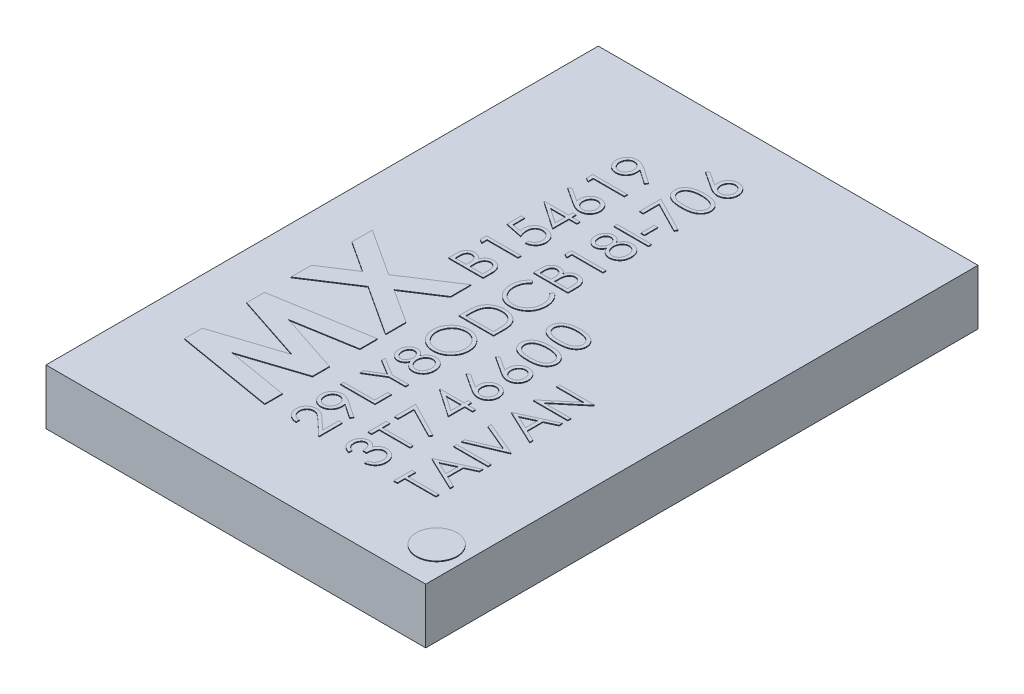
from build123d import *

# Parameters (mm, degrees)
ESQUISSE1_W        = 5.5
ESQUISSE1_H        = 8
BOSS_EXTRU_1_DEPTH = 0.8
ESQUISSE2_R        = 0.294488104
ESQUISSE2_W        = 0.5
ESQUISSE2_H        = 0.044871795
ESQUISSE2_W_2      = 0.051282051
ESQUISSE2_H_2      = 0.192307693
BOSS_EXTRU_2_DEPTH = 0.01


with BuildPart() as part:
    # Esquisse1 → Boss.-Extru.1 (new body)
    with BuildSketch(Plane(origin=(0, 0, 0), x_dir=(1, 0, 0), z_dir=(0, 1, 0))):
        Rectangle(ESQUISSE1_W, ESQUISSE1_H)
    extrude(amount=BOSS_EXTRU_1_DEPTH)

    # Esquisse2 → Boss.-Extru.2 (add)
    # profile 1 of 40: a face of its own
    with BuildSketch(Plane(origin=(0, 0.8, 0), x_dir=(1, 0, 0), z_dir=(0, 1, 0))):
        with Locations((2.340891929, -3.432066144)):
            Circle(ESQUISSE2_R)
    # profile 2 of 40: a face of its own
    with BuildSketch(Plane(origin=(0, 0.8, 0), x_dir=(1, 0, 0), z_dir=(0, 1, 0))):
        Polygon((-2.068081286, -2.677429191), (-2.068081286, -2.416611884), (-1.09155885, -2.097180794), (-2.068081286, -1.775506114), (-2.068081286, -1.517212845), (-0.668081286, -1.280514127), (-0.668081286, -1.534881114), (-1.552336093, -1.684360281), (-0.668081286, -1.97546605), (-0.668081286, -2.22057823), (-1.552336093, -2.510001307), (-0.668081286, -2.659200025), (-0.668081286, -2.91384746), align=None)
    # profile 3 of 40: a face of its own
    with BuildSketch(Plane(origin=(0, 0.8, 0), x_dir=(1, 0, 0), z_dir=(0, 1, 0))):
        Polygon((-2.068081286, -1.132717653), (-2.068081286, -0.836563807), (-1.618521991, -0.544055794), (-2.068081286, -0.250986884), (-2.068081286, 0.045447411), (-1.39107808, -0.395978871), (-0.668081286, 0.074614078), (-0.668081286, -0.221539768), (-1.163914619, -0.544055794), (-0.668081286, -0.867413166), (-0.668081286, -1.16384746), (-1.391358529, -0.692132717), align=None)
    # profile 4 of 40: a face of its own
    with BuildSketch(Plane(origin=(0, 0.8, 0), x_dir=(1, 0, 0), z_dir=(0, 1, 0))):
        with BuildLine():
            Line((-1.168081286, 0.25), (-1.168081286, 0.34755609))
            add(Edge.make_bspline(
                [(-1.168081286, 0.34755609), (-1.168056574, 0.352331662), (-1.168008676, 0.361587909), (-1.167248571, 0.375046806), (-1.166238084, 0.387657325), (-1.164543045, 0.399397181), (-1.162785515, 0.410342764), (-1.16020588, 0.420382953), (-1.157356579, 0.429601848), (-1.152972544, 0.440671853), (-1.146164081, 0.453232291), (-1.136066485, 0.466732412), (-1.123960281, 0.478467541), (-1.110164308, 0.488445879), (-1.094987174, 0.496453707), (-1.07875542, 0.502173727), (-1.061742126, 0.505848485), (-1.05007794, 0.50622166), (-1.044183048, 0.506410256)],
                knots=[0, 0, 0, 0, 1.00128172, 1.940733171, 2.826250472, 3.653024905, 4.427672124, 5.149348099, 5.824709082, 6.450061444, 7.643590664, 8.808605388, 9.972104426, 11.165284501, 12.367876273, 13.557044126, 14.765369432, 16, 16, 16, 16], degree=3))
            add(Edge.make_bspline(
                [(-1.044183048, 0.506410256), (-1.038661497, 0.506253169), (-1.027811129, 0.505944478), (-1.011968581, 0.503028625), (-0.996903243, 0.49840075), (-0.98262801, 0.492004839), (-0.969408616, 0.483764067), (-0.957286012, 0.473890463), (-0.946718365, 0.462027407), (-0.940812678, 0.45313482), (-0.937812856, 0.448617788)],
                knots=[0, 0, 0, 0, 1.044641374, 2.052818814, 3.038628718, 4.023282556, 5.005660861, 5.98021751, 6.974042014, 8, 8, 8, 8], degree=3))
            add(Edge.make_bspline(
                [(-0.937812856, 0.448617788), (-0.935631436, 0.454297301), (-0.931457838, 0.465163616), (-0.924090505, 0.480125876), (-0.916048356, 0.492969803), (-0.907401609, 0.503946295), (-0.897943876, 0.513284449), (-0.887598318, 0.521371831), (-0.876373403, 0.528363529), (-0.864310387, 0.534313417), (-0.851511533, 0.538987127), (-0.838133168, 0.54242224), (-0.824226576, 0.544454183), (-0.814789284, 0.544731372), (-0.810008369, 0.544871795)],
                knots=[0, 0, 0, 0, 1.272586185, 2.434772614, 3.483318042, 4.437947805, 5.351807173, 6.25737843, 7.180033415, 8.1141739, 9.066731021, 10.025721652, 10.999834114, 12, 12, 12, 12], degree=3))
            add(Edge.make_bspline(
                [(-0.810008369, 0.544871795), (-0.805127367, 0.544732276), (-0.79552386, 0.544457769), (-0.781416267, 0.542431623), (-0.767933089, 0.539003351), (-0.754993328, 0.534273011), (-0.742624113, 0.528141702), (-0.730870255, 0.520572258), (-0.719707299, 0.511670939), (-0.709115544, 0.50161101), (-0.699423756, 0.490400005), (-0.691092086, 0.478044757), (-0.683928037, 0.464883738), (-0.678095324, 0.450748698), (-0.67359539, 0.43567572), (-0.670460174, 0.419673192), (-0.668344125, 0.402767467), (-0.668170385, 0.391165989), (-0.668081286, 0.385216346)],
                knots=[0, 0, 0, 0, 0.978680899, 1.925582087, 2.851223405, 3.764209995, 4.683484765, 5.614004905, 6.562443559, 7.542772147, 8.539900013, 9.527881485, 10.525548727, 11.540192123, 12.58875426, 13.674701727, 14.807505862, 16, 16, 16, 16], degree=3))
            Line((-0.668081286, 0.385216346), (-0.668081286, 0.25))
            Line((-0.668081286, 0.25), (-1.168081286, 0.25))
        make_face()
        with BuildLine():
            Line((-1.116799234, 0.294871795), (-0.956542824, 0.294871795))
            Line((-0.956542824, 0.294871795), (-0.956542824, 0.325020032))
            add(Edge.make_bspline(
                [(-0.956542824, 0.325020032), (-0.956599956, 0.329427003), (-0.956710346, 0.337942168), (-0.957026563, 0.350273582), (-0.957911997, 0.361720014), (-0.958797179, 0.372261703), (-0.960236402, 0.381882057), (-0.961949575, 0.390559736), (-0.963761376, 0.398431014), (-0.966842914, 0.407507879), (-0.971395628, 0.417805457), (-0.978467929, 0.428775918), (-0.986884859, 0.438492178), (-0.996687676, 0.446598621), (-1.007364668, 0.4532917), (-1.0188221, 0.457980413), (-1.030829406, 0.461106238), (-1.039088354, 0.461392911), (-1.043281606, 0.461538462)],
                knots=[0, 0, 0, 0, 1.156917035, 2.235399477, 3.236897345, 4.169954739, 5.01148057, 5.788325709, 6.491867502, 7.129259015, 8.302032419, 9.437271567, 10.542795419, 11.662606952, 12.764338259, 13.836858145, 14.901724648, 16, 16, 16, 16], degree=3))
            add(Edge.make_bspline(
                [(-1.043281606, 0.461538462), (-1.04605708, 0.46146456), (-1.051501475, 0.461319594), (-1.059463932, 0.460089191), (-1.06694572, 0.458095611), (-1.074018646, 0.455395766), (-1.080506932, 0.451707377), (-1.086720604, 0.44743205), (-1.092287494, 0.442153552), (-1.097475614, 0.436188381), (-1.102118963, 0.429363161), (-1.105965259, 0.421530842), (-1.10945128, 0.412893903), (-1.112031878, 0.403218019), (-1.11430111, 0.392703676), (-1.115726883, 0.381208507), (-1.116644382, 0.368805355), (-1.116746466, 0.360211528), (-1.116799234, 0.355769231)],
                knots=[0, 0, 0, 0, 0.911708768, 1.788416306, 2.640049961, 3.452993646, 4.268229297, 5.087074648, 5.92553149, 6.781184137, 7.681934069, 8.628939405, 9.643570426, 10.73771997, 11.914765019, 13.176320755, 14.540391495, 16, 16, 16, 16], degree=3))
            Line((-1.116799234, 0.355769231), (-1.116799234, 0.294871795))
        make_face(mode=Mode.SUBTRACT)
        with BuildLine():
            Line((-0.905260773, 0.294871795), (-0.719363337, 0.294871795))
            Line((-0.719363337, 0.294871795), (-0.719363337, 0.358774038))
            add(Edge.make_bspline(
                [(-0.719363337, 0.358774038), (-0.719423609, 0.363347692), (-0.719539775, 0.372162807), (-0.71981221, 0.384900342), (-0.720842789, 0.39667526), (-0.721793494, 0.407524707), (-0.723419158, 0.417419888), (-0.724953362, 0.426436919), (-0.727230779, 0.434427778), (-0.73036082, 0.443778932), (-0.735371627, 0.454231361), (-0.74269237, 0.465653984), (-0.751727296, 0.475614334), (-0.762002813, 0.484164365), (-0.773144609, 0.491220222), (-0.785007027, 0.496283467), (-0.797359365, 0.499429948), (-0.805783546, 0.4998096), (-0.810008369, 0.5)],
                knots=[0, 0, 0, 0, 1.160376723, 2.23647316, 3.230273494, 4.158083346, 4.997711197, 5.773399541, 6.476071462, 7.102777513, 8.27340052, 9.405620712, 10.53304798, 11.669441455, 12.787990954, 13.865552736, 14.929550474, 16, 16, 16, 16], degree=3))
            add(Edge.make_bspline(
                [(-0.810008369, 0.5), (-0.812650332, 0.499960677), (-0.817891642, 0.499882666), (-0.825593072, 0.498700817), (-0.833056976, 0.496991057), (-0.840314457, 0.494739252), (-0.847243489, 0.491591352), (-0.853870647, 0.487732289), (-0.860329431, 0.483314906), (-0.868600463, 0.47649972), (-0.87801175, 0.466442244), (-0.887112165, 0.452149448), (-0.894569867, 0.435987764), (-0.897722664, 0.424238458), (-0.899351318, 0.418169071)],
                knots=[0, 0, 0, 0, 0.723302347, 1.434937762, 2.129609326, 2.821140842, 3.513216847, 4.209993937, 4.920569932, 5.655069131, 7.14393391, 8.6716197, 10.280644748, 12, 12, 12, 12], degree=3))
            add(Edge.make_bspline(
                [(-0.899351318, 0.418169071), (-0.899844901, 0.415736343), (-0.900915092, 0.410461686), (-0.902044764, 0.401860604), (-0.903051201, 0.392041194), (-0.903795652, 0.380980783), (-0.904565158, 0.368665377), (-0.904864418, 0.355068674), (-0.905221455, 0.340246201), (-0.905247332, 0.329961576), (-0.905260773, 0.324619391)],
                knots=[0, 0, 0, 0, 0.634451884, 1.375622551, 2.216452059, 3.157844607, 4.20941857, 5.370758133, 6.634282058, 8, 8, 8, 8], degree=3))
            Line((-0.905260773, 0.324619391), (-0.905260773, 0.294871795))
        make_face(mode=Mode.SUBTRACT)
    # profile 5 of 40: a face of its own
    with BuildSketch(Plane(origin=(0, 0.8, 0), x_dir=(1, 0, 0), z_dir=(0, 1, 0))):
        Polygon((-1.168081286, 0.708834135), (-1.168081286, 0.801282051), (-0.668081286, 0.801282051), (-0.668081286, 0.756410256), (-1.116799234, 0.756410256), (-1.116799234, 0.679487179), align=None)
    # profile 6 of 40: a face of its own
    with BuildSketch(Plane(origin=(0, 0.8, 0), x_dir=(1, 0, 0), z_dir=(0, 1, 0))):
        with BuildLine():
            Line((-1.168081286, 1.301282051), (-1.116799234, 1.301282051))
            Line((-1.116799234, 1.301282051), (-1.116799234, 1.131209936))
            Line((-1.116799234, 1.131209936), (-0.985288818, 1.104266827))
            add(Edge.make_bspline(
                [(-0.985288818, 1.104266827), (-0.986750285, 1.109560523), (-0.989581647, 1.119816223), (-0.992725328, 1.134953346), (-0.994620392, 1.14932366), (-0.99487915, 1.158648713), (-0.995004362, 1.163161058)],
                knots=[0, 0, 0, 0, 1.100273476, 2.13160584, 3.095893838, 4, 4, 4, 4], degree=3))
            add(Edge.make_bspline(
                [(-0.995004362, 1.163161058), (-0.994887505, 1.168745474), (-0.994657736, 1.179725832), (-0.992320426, 1.195766447), (-0.988935025, 1.211156066), (-0.983719172, 1.225667464), (-0.977349686, 1.239530224), (-0.969327179, 1.252506271), (-0.959960923, 1.264777725), (-0.949299154, 1.27625977), (-0.937443351, 1.286627341), (-0.924643276, 1.295636419), (-0.911178248, 1.303499673), (-0.896732675, 1.309632305), (-0.881579004, 1.314637131), (-0.865542312, 1.317937326), (-0.848764967, 1.320141713), (-0.837292753, 1.32038749), (-0.831442664, 1.320512821)],
                knots=[0, 0, 0, 0, 1.052805225, 2.070078116, 3.052532748, 4.020689046, 4.973125432, 5.925915817, 6.89216474, 7.881560752, 8.877013184, 9.857446635, 10.830895175, 11.812622661, 12.812548702, 13.836681939, 14.896847428, 16, 16, 16, 16], degree=3))
            add(Edge.make_bspline(
                [(-0.831442664, 1.320512821), (-0.827368086, 1.320417724), (-0.819273996, 1.320228817), (-0.807253022, 1.319270273), (-0.795488292, 1.317417646), (-0.784001373, 1.314960486), (-0.772781507, 1.311680299), (-0.761765876, 1.307843525), (-0.751075098, 1.303074668), (-0.740661957, 1.297787857), (-0.730645629, 1.291933711), (-0.721266272, 1.285350854), (-0.712309848, 1.278510885), (-0.704042349, 1.271036957), (-0.696431707, 1.263014044), (-0.689440296, 1.254486786), (-0.682942642, 1.245532526), (-0.677204415, 1.236010236), (-0.671923969, 1.226132769), (-0.667592042, 1.215757301), (-0.663719108, 1.20512006), (-0.660632033, 1.194067934), (-0.658213096, 1.182625961), (-0.656570153, 1.170775279), (-0.655373519, 1.158578041), (-0.655298611, 1.150310182), (-0.655260773, 1.146133814)],
                knots=[0, 0, 0, 0, 1.056393913, 2.098511576, 3.122979385, 4.141471433, 5.141222888, 6.151259816, 7.162667642, 8.172852865, 9.177685681, 10.166741883, 11.141342384, 12.097242845, 13.052202613, 14.005160326, 14.953864445, 15.917140761, 16.884916217, 17.854238259, 18.828761908, 19.81781811, 20.826036654, 21.857789401, 22.917898972, 24, 24, 24, 24], degree=3))
            add(Edge.make_bspline(
                [(-0.655260773, 1.146133814), (-0.655359729, 1.141151915), (-0.655554415, 1.131350618), (-0.657581843, 1.116988726), (-0.660504791, 1.103178967), (-0.664835295, 1.089980527), (-0.670505783, 1.077448452), (-0.67724318, 1.065403284), (-0.685263948, 1.053994319), (-0.694494724, 1.043299556), (-0.704637402, 1.033468698), (-0.715538794, 1.024554003), (-0.727212784, 1.016716341), (-0.73962141, 1.00992728), (-0.752742664, 1.004143618), (-0.766616974, 0.999598132), (-0.781174228, 0.995929929), (-0.791196143, 0.994377993), (-0.796286414, 0.993589744)],
                knots=[0, 0, 0, 0, 1.046872515, 2.059598001, 3.044168548, 4.012104806, 4.973680974, 5.932408326, 6.910122221, 7.900780896, 8.89867654, 9.876692837, 10.858029398, 11.85084981, 12.847361615, 13.868568023, 14.917415949, 16, 16, 16, 16], degree=3))
            Line((-0.796286414, 0.993589744), (-0.796286414, 1.038461538))
            add(Edge.make_bspline(
                [(-0.796286414, 1.038461538), (-0.791517853, 1.039564927), (-0.782352413, 1.041685702), (-0.769483114, 1.046352858), (-0.758010945, 1.052003853), (-0.747865765, 1.05888013), (-0.738861868, 1.066850615), (-0.730923153, 1.076115892), (-0.723752325, 1.086444332), (-0.717764824, 1.097927529), (-0.712721162, 1.110065824), (-0.70912184, 1.122697695), (-0.706943092, 1.135641345), (-0.706676749, 1.144356005), (-0.706542824, 1.148737981)],
                knots=[0, 0, 0, 0, 1.13623081, 2.183898708, 3.172478118, 4.09966615, 5.022692284, 5.957376522, 6.927682873, 7.937366477, 8.960015386, 9.976409503, 10.982481913, 12, 12, 12, 12], degree=3))
            add(Edge.make_bspline(
                [(-0.706542824, 1.148737981), (-0.706661059, 1.153017395), (-0.706893865, 1.161443598), (-0.708656795, 1.173850432), (-0.711443227, 1.185793754), (-0.71534686, 1.197294765), (-0.720511137, 1.208296951), (-0.726855153, 1.218784756), (-0.734220632, 1.228907589), (-0.742639105, 1.23839903), (-0.751921537, 1.247089922), (-0.761846605, 1.254769488), (-0.772434798, 1.261166158), (-0.783502372, 1.266556754), (-0.795170743, 1.27065008), (-0.807385195, 1.273570221), (-0.820175907, 1.275284943), (-0.828900094, 1.275520826), (-0.833345709, 1.275641026)],
                knots=[0, 0, 0, 0, 1.027268864, 2.022700798, 3.002744649, 3.968653148, 4.933396556, 5.915045722, 6.907600446, 7.935526002, 8.956456544, 9.95700807, 10.942805781, 11.92166854, 12.907987664, 13.905483474, 14.932689774, 16, 16, 16, 16], degree=3))
            add(Edge.make_bspline(
                [(-0.833345709, 1.275641026), (-0.837357004, 1.275549815), (-0.845175435, 1.275372037), (-0.856654099, 1.273833022), (-0.867532497, 1.271262122), (-0.877857961, 1.267601682), (-0.887597479, 1.263033337), (-0.896729587, 1.257297641), (-0.905340152, 1.250638824), (-0.913207587, 1.242864807), (-0.920480298, 1.234408286), (-0.926657611, 1.225052054), (-0.931910914, 1.215045888), (-0.936215066, 1.204371244), (-0.939643653, 1.193014975), (-0.942013197, 1.180970963), (-0.943431096, 1.168236464), (-0.943623441, 1.159525657), (-0.943722311, 1.155048077)],
                knots=[0, 0, 0, 0, 1.045723156, 2.038222538, 3.013889863, 3.95567481, 4.890389958, 5.81331128, 6.76251276, 7.723027653, 8.692928204, 9.666105983, 10.639751036, 11.635719707, 12.66315958, 13.728667616, 14.832476222, 16, 16, 16, 16], degree=3))
            add(Edge.make_bspline(
                [(-0.943722311, 1.155048077), (-0.94363937, 1.151172516), (-0.943468116, 1.143170465), (-0.942207188, 1.130895775), (-0.940173003, 1.117996958), (-0.937374968, 1.104523458), (-0.933713385, 1.090434814), (-0.9293256, 1.075760757), (-0.9240796, 1.060470433), (-0.920117855, 1.050167901), (-0.918081286, 1.044871795)],
                knots=[0, 0, 0, 0, 0.817624296, 1.688186739, 2.600797293, 3.572016777, 4.590301741, 5.671205678, 6.80286297, 8, 8, 8, 8], degree=3))
            Line((-0.918081286, 1.044871795), (-1.168081286, 1.096153846))
            Line((-1.168081286, 1.096153846), (-1.168081286, 1.301282051))
        make_face()
    # profile 7 of 40: a face of its own
    with BuildSketch(Plane(origin=(0, 0.8, 0), x_dir=(1, 0, 0), z_dir=(0, 1, 0))):
        Polygon((-1.180901798, 1.644731571), (-1.180901798, 1.653846154), (-0.834747952, 1.653846154), (-0.834747952, 1.711538462), (-0.783465901, 1.711538462), (-0.783465901, 1.653846154), (-0.668081286, 1.653846154), (-0.668081286, 1.608974359), (-0.783465901, 1.608974359), (-0.783465901, 1.371794872), align=None)
        Polygon((-0.834747952, 1.608974359), (-1.051895388, 1.608974359), (-0.834747952, 1.459935897), align=None, mode=Mode.SUBTRACT)
    # profile 8 of 40: a face of its own
    with BuildSketch(Plane(origin=(0, 0.8, 0), x_dir=(1, 0, 0), z_dir=(0, 1, 0))):
        with BuildLine():
            Line((-1.180901798, 1.987179487), (-1.153758369, 2.021734776))
            Line((-1.153758369, 2.021734776), (-0.951735132, 1.889623397))
            add(Edge.make_bspline(
                [(-0.951735132, 1.889623397), (-0.953137112, 1.898419151), (-0.955871832, 1.915576264), (-0.956322968, 1.932942821), (-0.956542824, 1.94140625)],
                knots=[0, 0, 0, 0, 1.025318673, 2, 2, 2, 2], degree=3))
            add(Edge.make_bspline(
                [(-0.956542824, 1.94140625), (-0.956406237, 1.946488035), (-0.956137368, 1.956491378), (-0.954068247, 1.971178064), (-0.950807517, 1.98529077), (-0.946054336, 1.998770998), (-0.939982575, 2.011667146), (-0.932705581, 2.024053174), (-0.923847675, 2.035696427), (-0.913952496, 2.046746178), (-0.902993615, 2.056780172), (-0.891362364, 2.065656856), (-0.879059664, 2.073153958), (-0.86608828, 2.079126941), (-0.852549752, 2.083900412), (-0.838391278, 2.087298542), (-0.823588961, 2.089329996), (-0.81352035, 2.089604268), (-0.808405805, 2.08974359)],
                knots=[0, 0, 0, 0, 1.043709831, 2.054511743, 3.041122595, 4.01515914, 4.98481438, 5.965901842, 6.960491961, 7.985277438, 9.0096037, 10.00832444, 10.987059228, 11.962929573, 12.936966118, 13.931840027, 14.949438142, 16, 16, 16, 16], degree=3))
            add(Edge.make_bspline(
                [(-0.808405805, 2.08974359), (-0.801408442, 2.089540783), (-0.787639289, 2.089141708), (-0.767589215, 2.085148393), (-0.748499309, 2.078989491), (-0.730699896, 2.070045425), (-0.714067697, 2.059146453), (-0.699379027, 2.045692015), (-0.686279074, 2.030349645), (-0.675329307, 2.012992523), (-0.666385694, 1.994315463), (-0.659962173, 1.974693614), (-0.656007369, 1.954318343), (-0.655511572, 1.940489108), (-0.655260773, 1.93349359)],
                knots=[0, 0, 0, 0, 1.031403119, 2.029557249, 3.004870281, 3.983165322, 4.960181699, 5.929903783, 6.912123683, 7.928973898, 8.949315281, 9.960468141, 10.968302741, 12, 12, 12, 12], degree=3))
            add(Edge.make_bspline(
                [(-0.655260773, 1.93349359), (-0.655478467, 1.926765206), (-0.655909683, 1.913437457), (-0.659771033, 1.893836914), (-0.665985109, 1.87496983), (-0.674725621, 1.85707839), (-0.685579508, 1.840477165), (-0.698555072, 1.825506198), (-0.71367034, 1.812566722), (-0.730594657, 1.801701458), (-0.748755652, 1.793047277), (-0.767725051, 1.786618019), (-0.787423216, 1.782842733), (-0.800777911, 1.782316389), (-0.807504362, 1.782051282)],
                knots=[0, 0, 0, 0, 1.012172929, 2.004937354, 2.995255351, 3.995689452, 4.993936421, 5.973737378, 6.968231049, 7.979117505, 8.993136101, 9.989812463, 10.987515067, 12, 12, 12, 12], degree=3))
            add(Edge.make_bspline(
                [(-0.807504362, 1.782051282), (-0.812653589, 1.78222006), (-0.823167325, 1.782564672), (-0.839090757, 1.784970871), (-0.855383769, 1.78883727), (-0.869205797, 1.793167305), (-0.880528871, 1.797742392), (-0.889657941, 1.801549898), (-0.89905238, 1.80628904), (-0.909034328, 1.81134238), (-0.919346533, 1.81716479), (-0.930161343, 1.823495597), (-0.941306761, 1.830509833), (-0.948870217, 1.835426999), (-0.952736734, 1.837940705)],
                knots=[0, 0, 0, 0, 1.173818275, 2.396712641, 3.66331629, 4.989737886, 5.693666774, 6.447286557, 7.243889047, 8.091586357, 8.998013824, 9.943181721, 10.948533338, 12, 12, 12, 12], degree=3))
            Line((-0.952736734, 1.837940705), (-1.180901798, 1.987179487))
        make_face()
        with BuildLine():
            add(Edge.make_bspline(
                [(-0.905260773, 1.931991186), (-0.905150697, 1.928181923), (-0.904935686, 1.920741325), (-0.903659926, 1.909831171), (-0.901337898, 1.89947192), (-0.898118203, 1.889660566), (-0.894148696, 1.880336583), (-0.889055471, 1.871684747), (-0.883123025, 1.863527022), (-0.876362092, 1.855993748), (-0.86896477, 1.849161965), (-0.861040301, 1.843279051), (-0.852781194, 1.838204395), (-0.844118042, 1.834078428), (-0.835054261, 1.830865558), (-0.82563151, 1.828541523), (-0.81578661, 1.82724813), (-0.809110538, 1.827032954), (-0.805701478, 1.826923077)],
                knots=[0, 0, 0, 0, 1.129656352, 2.206547016, 3.251334079, 4.271920891, 5.265058649, 6.249872215, 7.241923875, 8.251504132, 9.246416584, 10.222533834, 11.173322129, 12.116503788, 13.062124155, 14.020151864, 14.989013135, 16, 16, 16, 16], degree=3))
            add(Edge.make_bspline(
                [(-0.805701478, 1.826923077), (-0.8023235, 1.827015726), (-0.795666779, 1.827198302), (-0.785895393, 1.828752753), (-0.776513655, 1.831237381), (-0.767556823, 1.834826593), (-0.75885295, 1.839188202), (-0.750673739, 1.844786661), (-0.742754248, 1.851212067), (-0.735462442, 1.858714315), (-0.728693026, 1.866827214), (-0.7227516, 1.875476716), (-0.717727508, 1.884532586), (-0.713564493, 1.893968745), (-0.71049992, 1.903901834), (-0.708153823, 1.914170565), (-0.706871179, 1.924914554), (-0.706653712, 1.932188425), (-0.706542824, 1.935897436)],
                knots=[0, 0, 0, 0, 0.989367052, 1.949669134, 2.891858276, 3.827522767, 4.772653562, 5.738670152, 6.725809442, 7.756636004, 8.798867547, 9.819240912, 10.826537776, 11.829883227, 12.835515726, 13.868058748, 14.912904531, 16, 16, 16, 16], degree=3))
            add(Edge.make_bspline(
                [(-0.706542824, 1.935897436), (-0.706653721, 1.93960644), (-0.706871205, 1.9468803), (-0.708153725, 1.957624375), (-0.710500276, 1.967892787), (-0.713563202, 1.977827036), (-0.717732324, 1.987258892), (-0.722720159, 1.996306847), (-0.728729456, 2.004874543), (-0.735450819, 2.012992722), (-0.742795914, 2.020463792), (-0.750602381, 2.027040316), (-0.758918397, 2.032463868), (-0.7675226, 2.03699841), (-0.776519005, 2.040547881), (-0.785893933, 2.043044742), (-0.79566716, 2.044595886), (-0.802323628, 2.044778916), (-0.805701478, 2.044871795)],
                knots=[0, 0, 0, 0, 1.087281468, 2.132306021, 3.165025708, 4.170830268, 5.174347389, 6.181816599, 7.194310624, 8.23672049, 9.267723423, 10.261267456, 11.222032883, 12.171822355, 13.107646935, 14.049997283, 15.01046367, 16, 16, 16, 16], degree=3))
            add(Edge.make_bspline(
                [(-0.805701478, 2.044871795), (-0.809114985, 2.044793182), (-0.81581459, 2.044638889), (-0.825627106, 2.042893754), (-0.835102137, 2.040473415), (-0.844180125, 2.036818695), (-0.852825275, 2.032070623), (-0.861081152, 2.026287254), (-0.86901146, 2.019596988), (-0.876376567, 2.011868371), (-0.883115695, 2.00345699), (-0.889047312, 1.994506375), (-0.894110564, 1.985179735), (-0.898105871, 1.97534569), (-0.901324535, 1.965136557), (-0.903651647, 1.95448184), (-0.904932361, 1.943373961), (-0.905149908, 1.935833772), (-0.905260773, 1.931991186)],
                knots=[0, 0, 0, 0, 0.978259475, 1.920005202, 2.851759169, 3.7803069, 4.719124913, 5.675758531, 6.668034766, 7.691045932, 8.733780038, 9.756656648, 10.768121246, 11.773215211, 12.79725739, 13.836288844, 14.897342417, 16, 16, 16, 16], degree=3))
        make_face(mode=Mode.SUBTRACT)
    # profile 9 of 40: a face of its own
    with BuildSketch(Plane(origin=(0, 0.8, 0), x_dir=(1, 0, 0), z_dir=(0, 1, 0))):
        Polygon((-1.168081286, 2.247295673), (-1.168081286, 2.33974359), (-0.668081286, 2.33974359), (-0.668081286, 2.294871795), (-1.116799234, 2.294871795), (-1.116799234, 2.217948718), align=None)
    # profile 10 of 40: a face of its own
    with BuildSketch(Plane(origin=(0, 0.8, 0), x_dir=(1, 0, 0), z_dir=(0, 1, 0))):
        with BuildLine():
            Line((-0.655260773, 2.634615385), (-0.680200677, 2.598758013))
            Line((-0.680200677, 2.598758013), (-0.883425837, 2.737780449))
            add(Edge.make_bspline(
                [(-0.883425837, 2.737780449), (-0.882290498, 2.72891157), (-0.880055547, 2.71145289), (-0.879763457, 2.693854737), (-0.879619747, 2.685196314)],
                knots=[0, 0, 0, 0, 1.015985029, 2, 2, 2, 2], degree=3))
            add(Edge.make_bspline(
                [(-0.879619747, 2.685196314), (-0.879754187, 2.67994745), (-0.88001808, 2.669644389), (-0.882109766, 2.65449701), (-0.885331213, 2.639941931), (-0.890138177, 2.626017735), (-0.896112211, 2.612672099), (-0.903520342, 2.59993411), (-0.91223558, 2.587821098), (-0.922211518, 2.576462459), (-0.933166279, 2.56613383), (-0.944757227, 2.556924664), (-0.957109486, 2.549312815), (-0.969962545, 2.542876763), (-0.983590738, 2.538132637), (-0.99776282, 2.53459446), (-1.012566763, 2.532440012), (-1.022641468, 2.532182188), (-1.027756766, 2.532051282)],
                knots=[0, 0, 0, 0, 1.060698949, 2.082059282, 3.085738422, 4.069684654, 5.054463875, 6.037298355, 7.043153692, 8.066652628, 9.088369706, 10.083456696, 11.053578809, 12.016466116, 12.983507685, 13.964045196, 14.966270913, 16, 16, 16, 16], degree=3))
            add(Edge.make_bspline(
                [(-1.027756766, 2.532051282), (-1.034752018, 2.532299556), (-1.048482279, 2.532786869), (-1.068548084, 2.536693856), (-1.087531663, 2.543167012), (-1.105411786, 2.552051082), (-1.121777747, 2.563455398), (-1.136574099, 2.576998868), (-1.149536894, 2.592790954), (-1.16066698, 2.610419352), (-1.169679444, 2.62944462), (-1.176082415, 2.649452635), (-1.180172783, 2.670106349), (-1.180657745, 2.684142405), (-1.180901798, 2.691205929)],
                knots=[0, 0, 0, 0, 1.023011052, 2.007963168, 2.978169221, 3.950402619, 4.919353283, 5.887490769, 6.876420893, 7.899700203, 8.931203047, 9.947778163, 10.96723692, 12, 12, 12, 12], degree=3))
            add(Edge.make_bspline(
                [(-1.180901798, 2.691205929), (-1.180640345, 2.698132844), (-1.180123738, 2.711819775), (-1.176340334, 2.731946809), (-1.169963589, 2.751223972), (-1.161151801, 2.769545155), (-1.150104872, 2.786506183), (-1.13694677, 2.801766257), (-1.121666509, 2.814920432), (-1.104683834, 2.826135392), (-1.086324489, 2.834970189), (-1.067197101, 2.841443852), (-1.047416723, 2.845400971), (-1.034017973, 2.845901328), (-1.027255965, 2.846153846)],
                knots=[0, 0, 0, 0, 1.026358223, 2.027987109, 3.023239252, 4.028077889, 5.032770297, 6.015020143, 7.004250571, 8.011656937, 9.02310243, 10.015224881, 10.998334443, 12, 12, 12, 12], degree=3))
            add(Edge.make_bspline(
                [(-1.027255965, 2.846153846), (-1.022007048, 2.845984752), (-1.011360934, 2.845641788), (-0.995214294, 2.843267468), (-0.978764155, 2.839171923), (-0.964827137, 2.834595719), (-0.953281068, 2.830110268), (-0.94413374, 2.826009904), (-0.934572664, 2.821246766), (-0.924558688, 2.81592721), (-0.914078746, 2.810061316), (-0.903205526, 2.803489621), (-0.891923175, 2.796300764), (-0.884316276, 2.791182564), (-0.880421029, 2.788561699)],
                knots=[0, 0, 0, 0, 1.179894106, 2.393120058, 3.660107319, 4.986885617, 5.687958251, 6.443931318, 7.239444731, 8.088894906, 8.992865148, 9.938946712, 10.944601238, 12, 12, 12, 12], degree=3))
            Line((-0.880421029, 2.788561699), (-0.655260773, 2.634615385))
        make_face()
        with BuildLine():
            add(Edge.make_bspline(
                [(-0.930901798, 2.693509615), (-0.93101065, 2.697485808), (-0.931222546, 2.705226102), (-0.932506459, 2.716567041), (-0.934799695, 2.72726573), (-0.938038064, 2.737391029), (-0.942140431, 2.746930679), (-0.947139837, 2.755887685), (-0.953145808, 2.764170555), (-0.95989664, 2.771808778), (-0.967295283, 2.778740698), (-0.975222242, 2.78471761), (-0.983431254, 2.789892534), (-0.992090369, 2.794020967), (-1.001057934, 2.797348061), (-1.010463637, 2.799669591), (-1.020242538, 2.800951804), (-1.026885126, 2.801170774), (-1.030260773, 2.801282051)],
                knots=[0, 0, 0, 0, 1.163726718, 2.265380301, 3.334713825, 4.36057981, 5.371541381, 6.368955992, 7.355979581, 8.359691305, 9.348261197, 10.317521986, 11.261029684, 12.183096459, 13.119698615, 14.055740009, 15.011961376, 16, 16, 16, 16], degree=3))
            add(Edge.make_bspline(
                [(-1.030260773, 2.801282051), (-1.033637914, 2.801186477), (-1.040292985, 2.800998136), (-1.050085141, 2.799484332), (-1.059472365, 2.796828546), (-1.068518564, 2.793229059), (-1.077174283, 2.788577268), (-1.085466805, 2.782940984), (-1.093270609, 2.776135051), (-1.100714307, 2.768529725), (-1.107467001, 2.760164775), (-1.113433176, 2.75130206), (-1.118468302, 2.741988924), (-1.12244433, 2.732183821), (-1.125701632, 2.722019903), (-1.128007506, 2.711391948), (-1.129292157, 2.700285269), (-1.129509159, 2.692744914), (-1.129619747, 2.688902244)],
                knots=[0, 0, 0, 0, 0.971910406, 1.91526867, 2.84337505, 3.775008003, 4.712374136, 5.666733183, 6.654995996, 7.688089235, 8.726800303, 9.745078658, 10.75990398, 11.768337501, 12.786615857, 13.829099629, 14.893678693, 16, 16, 16, 16], degree=3))
            add(Edge.make_bspline(
                [(-1.129619747, 2.688902244), (-1.129508978, 2.685092993), (-1.129291649, 2.677619274), (-1.128009974, 2.666611328), (-1.125685968, 2.656055252), (-1.122445806, 2.645920837), (-1.118467997, 2.636116019), (-1.11343291, 2.626803322), (-1.107468386, 2.617938542), (-1.100708931, 2.60958155), (-1.09330532, 2.601962516), (-1.085431935, 2.59527175), (-1.077178673, 2.589622719), (-1.068517404, 2.584977426), (-1.059472673, 2.581376221), (-1.050085057, 2.578720894), (-1.040293007, 2.577206967), (-1.033637921, 2.577018643), (-1.030260773, 2.576923077)],
                knots=[0, 0, 0, 0, 1.099107991, 2.156440826, 3.191784126, 4.212280276, 5.222910149, 6.239945746, 7.260441896, 8.30141526, 9.33675856, 10.320924759, 11.277362386, 12.216770088, 13.150432123, 14.080559904, 15.025972789, 16, 16, 16, 16], degree=3))
            add(Edge.make_bspline(
                [(-1.030260773, 2.576923077), (-1.026882508, 2.577009732), (-1.020219951, 2.577180631), (-1.010429759, 2.578826104), (-1.001048368, 2.581585194), (-0.991995696, 2.585243762), (-0.983388861, 2.590153667), (-0.975183231, 2.59612062), (-0.967211055, 2.603005466), (-0.959919773, 2.611033836), (-0.953113497, 2.619654916), (-0.9471776, 2.628914875), (-0.942200168, 2.638627629), (-0.938025971, 2.648730814), (-0.934832361, 2.65930003), (-0.932510719, 2.670320559), (-0.931234855, 2.681794387), (-0.931013882, 2.689567074), (-0.930901798, 2.693509615)],
                knots=[0, 0, 0, 0, 0.952872936, 1.879239831, 2.791748947, 3.708674669, 4.628500839, 5.580394867, 6.568761142, 7.595635223, 8.636123962, 9.665976811, 10.694276597, 11.712685318, 12.747011694, 13.805940053, 14.887106426, 16, 16, 16, 16], degree=3))
        make_face(mode=Mode.SUBTRACT)
    # profile 11 of 40: a face of its own
    with BuildSketch(Plane(origin=(0, 0.8, 0), x_dir=(1, 0, 0), z_dir=(0, 1, 0))):
        Polygon((1.283200766, -2.94333464), (1.231918714, -2.94333464), (1.231918714, -2.680514127), (1.283200766, -2.680514127), (1.283200766, -2.789488486), (1.731918714, -2.789488486), (1.731918714, -2.834360281), (1.283200766, -2.834360281), align=None)
    # profile 12 of 40: a face of its own
    with BuildSketch(Plane(origin=(0, 0.8, 0), x_dir=(1, 0, 0), z_dir=(0, 1, 0))):
        Polygon((1.231918714, -2.385642332), (1.731918714, -2.154873102), (1.731918714, -2.203651146), (1.571662304, -2.277569416), (1.571662304, -2.504232076), (1.731918714, -2.58025371), (1.731918714, -2.629232076), (1.231918714, -2.392052589), align=None)
        Polygon((1.329374644, -2.389348262), (1.520380253, -2.479893134), (1.520380253, -2.301207236), align=None, mode=Mode.SUBTRACT)
    # profile 13 of 40: a face of its own
    with BuildSketch(Plane(origin=(0, 0.8, 0), x_dir=(1, 0, 0), z_dir=(0, 1, 0))):
        with Locations((1.481918714, -2.055514128)):
            Rectangle(ESQUISSE2_W, ESQUISSE2_H)
    # profile 14 of 40: a face of its own
    with BuildSketch(Plane(origin=(0, 0.8, 0), x_dir=(1, 0, 0), z_dir=(0, 1, 0))):
        Polygon((1.231918714, -1.962565409), (1.231918714, -1.914488486), (1.625949163, -1.747821819), (1.231918714, -1.581155153), (1.231918714, -1.53307823), (1.731918714, -1.744616691), (1.731918714, -1.751026948), align=None)
    # profile 15 of 40: a face of its own
    with BuildSketch(Plane(origin=(0, 0.8, 0), x_dir=(1, 0, 0), z_dir=(0, 1, 0))):
        Polygon((1.231918714, -1.231796178), (1.731918714, -1.001026948), (1.731918714, -1.049804993), (1.571662304, -1.123723262), (1.571662304, -1.350385922), (1.731918714, -1.426407557), (1.731918714, -1.475385922), (1.231918714, -1.238206435), align=None)
        Polygon((1.329374644, -1.235502108), (1.520380253, -1.32604698), (1.520380253, -1.147361082), align=None, mode=Mode.SUBTRACT)
    # profile 16 of 40: a face of its own
    with BuildSketch(Plane(origin=(0, 0.8, 0), x_dir=(1, 0, 0), z_dir=(0, 1, 0))):
        Polygon((1.731918714, -0.924103871), (1.231918714, -0.924103871), (1.231918714, -0.914688807), (1.625448362, -0.584360281), (1.231918714, -0.584360281), (1.231918714, -0.539488486), (1.731918714, -0.539488486), (1.731918714, -0.549704832), (1.339290509, -0.879232076), (1.731918714, -0.879232076), align=None)
    # profile 17 of 40: a face of its own
    with BuildSketch(Plane(origin=(0, 0.8, 0), x_dir=(1, 0, 0), z_dir=(0, 1, 0))):
        with BuildLine():
            Line((-0.214235132, -2.866411563), (-0.214235132, -2.911283358))
            add(Edge.make_bspline(
                [(-0.214235132, -2.911283358), (-0.220188116, -2.910990907), (-0.231879618, -2.910416543), (-0.24892589, -2.907726787), (-0.265219433, -2.90387809), (-0.28062942, -2.898436454), (-0.295292107, -2.891678414), (-0.309149252, -2.883574125), (-0.322147994, -2.873975003), (-0.334167828, -2.863088327), (-0.345194624, -2.851264236), (-0.354716802, -2.838506244), (-0.362762183, -2.825099812), (-0.369488075, -2.811085612), (-0.374536624, -2.796305531), (-0.378282573, -2.780893695), (-0.380536337, -2.764782389), (-0.380778592, -2.753805243), (-0.380901798, -2.74822246)],
                knots=[0, 0, 0, 0, 1.10065271, 2.161652631, 3.183658789, 4.190468796, 5.17591951, 6.163126047, 7.15150782, 8.156236427, 9.156009102, 10.134482811, 11.092018607, 12.041330605, 13.001268258, 13.972401359, 14.968799086, 16, 16, 16, 16], degree=3))
            add(Edge.make_bspline(
                [(-0.380901798, -2.74822246), (-0.380774489, -2.742739493), (-0.380524331, -2.731965657), (-0.378343735, -2.71624797), (-0.375002166, -2.701249527), (-0.370050487, -2.687140306), (-0.363837213, -2.673775505), (-0.356110192, -2.661320604), (-0.347235043, -2.64947443), (-0.336766368, -2.638818372), (-0.325596266, -2.629029497), (-0.313666691, -2.620592079), (-0.301331143, -2.613325708), (-0.288493263, -2.607378411), (-0.275111246, -2.602870095), (-0.261313389, -2.599529865), (-0.246940455, -2.597620409), (-0.237210667, -2.597328965), (-0.232263978, -2.597180794)],
                knots=[0, 0, 0, 0, 1.111674182, 2.184400057, 3.212814286, 4.223731311, 5.211378316, 6.196328225, 7.191884489, 8.207283132, 9.220262353, 10.201199469, 11.166417575, 12.120932471, 13.06540007, 14.026332106, 14.996573967, 16, 16, 16, 16], degree=3))
            add(Edge.make_bspline(
                [(-0.232263978, -2.597180794), (-0.225300004, -2.597422692), (-0.211494266, -2.597902244), (-0.191206384, -2.602004242), (-0.171550349, -2.608411099), (-0.155730195, -2.616124323), (-0.14298376, -2.623907631), (-0.132483793, -2.630914506), (-0.121181127, -2.639163862), (-0.109030015, -2.64858522), (-0.096189584, -2.659340829), (-0.082397857, -2.671151259), (-0.067909851, -2.68432152), (-0.058007901, -2.693557038), (-0.052876959, -2.698342653)],
                knots=[0, 0, 0, 0, 1.184416499, 2.348048165, 3.509039915, 4.696071444, 5.333504901, 6.05069495, 6.844171097, 7.714965912, 8.667477798, 9.695072654, 10.805644396, 12, 12, 12, 12], degree=3))
            Line((-0.052876959, -2.698342653), (0.080636663, -2.823442813))
            Line((0.080636663, -2.823442813), (0.080636663, -2.590770537))
            Line((0.080636663, -2.590770537), (0.131918714, -2.590770537))
            Line((0.131918714, -2.590770537), (0.131918714, -2.930514127))
            Line((0.131918714, -2.930514127), (-0.075012375, -2.736603871))
            add(Edge.make_bspline(
                [(-0.075012375, -2.736603871), (-0.079940705, -2.731882744), (-0.089407017, -2.722814426), (-0.10322744, -2.709988344), (-0.116048803, -2.698468488), (-0.127846881, -2.688180289), (-0.138794248, -2.679346931), (-0.148536349, -2.671508041), (-0.15750127, -2.665227242), (-0.167892786, -2.658410757), (-0.18058026, -2.65180876), (-0.196085073, -2.646135566), (-0.212046109, -2.642676302), (-0.222832114, -2.642261325), (-0.228257568, -2.642052589)],
                knots=[0, 0, 0, 0, 1.329631726, 2.553950428, 3.673215718, 4.687767853, 5.603093632, 6.413772471, 7.123043292, 7.734684054, 8.834405432, 9.900288307, 10.943827018, 12, 12, 12, 12], degree=3))
            add(Edge.make_bspline(
                [(-0.228257568, -2.642052589), (-0.231669196, -2.642143409), (-0.23839286, -2.642322398), (-0.248250826, -2.64390207), (-0.257760085, -2.646289285), (-0.266949888, -2.649710036), (-0.275727838, -2.654225284), (-0.284104621, -2.659721482), (-0.292203044, -2.666062919), (-0.299796373, -2.673398815), (-0.306750831, -2.681457603), (-0.312911414, -2.689971068), (-0.318059859, -2.698978225), (-0.322280358, -2.7084411), (-0.325591127, -2.71833331), (-0.32788521, -2.728673988), (-0.329325565, -2.739434561), (-0.329520446, -2.746782204), (-0.329619747, -2.750526146)],
                knots=[0, 0, 0, 0, 0.991446411, 1.95395049, 2.89581595, 3.838931463, 4.798493298, 5.75982156, 6.748411868, 7.785213223, 8.824556874, 9.840280684, 10.836137867, 11.835679398, 12.848801643, 13.863922112, 14.911575587, 16, 16, 16, 16], degree=3))
            add(Edge.make_bspline(
                [(-0.329619747, -2.750526146), (-0.32952163, -2.754437247), (-0.329328945, -2.762118002), (-0.32786945, -2.773371115), (-0.325656854, -2.784180221), (-0.32214277, -2.794384038), (-0.317990705, -2.804203523), (-0.312715954, -2.813429047), (-0.306586576, -2.822213781), (-0.299479312, -2.830413233), (-0.291493788, -2.837901942), (-0.282693188, -2.844574273), (-0.273140871, -2.850365856), (-0.262876041, -2.855426016), (-0.251796499, -2.859533495), (-0.239944092, -2.862672652), (-0.227369575, -2.865156449), (-0.218685996, -2.865986243), (-0.214235132, -2.866411563)],
                knots=[0, 0, 0, 0, 1.030878251, 2.024474673, 2.987898669, 3.934362936, 4.864849709, 5.795128259, 6.730474222, 7.685293701, 8.650606017, 9.611896181, 10.591709709, 11.591680886, 12.625074257, 13.701333388, 14.821793024, 16, 16, 16, 16], degree=3))
        make_face()
    # profile 18 of 40: a face of its own
    with BuildSketch(Plane(origin=(0, 0.8, 0), x_dir=(1, 0, 0), z_dir=(0, 1, 0))):
        with BuildLine():
            Line((0.144739227, -2.436924384), (0.119799323, -2.472781755))
            Line((0.119799323, -2.472781755), (-0.083425837, -2.333759319))
            add(Edge.make_bspline(
                [(-0.083425837, -2.333759319), (-0.082290498, -2.342628198), (-0.080055547, -2.360086878), (-0.079763457, -2.377685031), (-0.079619747, -2.386343454)],
                knots=[0, 0, 0, 0, 1.015985029, 2, 2, 2, 2], degree=3))
            add(Edge.make_bspline(
                [(-0.079619747, -2.386343454), (-0.079754187, -2.391592318), (-0.08001808, -2.401895379), (-0.082109766, -2.417042758), (-0.085331213, -2.431597838), (-0.090138177, -2.445522033), (-0.096112211, -2.458867669), (-0.103520342, -2.471605658), (-0.11223558, -2.483718671), (-0.122211518, -2.495077309), (-0.133166279, -2.505405938), (-0.144757227, -2.514615104), (-0.157109486, -2.522226953), (-0.169962545, -2.528663005), (-0.183590738, -2.533407131), (-0.19776282, -2.536945308), (-0.212566763, -2.539099757), (-0.222641468, -2.53935758), (-0.227756766, -2.539488486)],
                knots=[0, 0, 0, 0, 1.060698949, 2.082059282, 3.085738422, 4.069684654, 5.054463875, 6.037298355, 7.043153692, 8.066652628, 9.088369706, 10.083456696, 11.053578809, 12.016466116, 12.983507685, 13.964045196, 14.966270913, 16, 16, 16, 16], degree=3))
            add(Edge.make_bspline(
                [(-0.227756766, -2.539488486), (-0.234752018, -2.539240212), (-0.248482279, -2.538752899), (-0.268548084, -2.534845913), (-0.287531663, -2.528372756), (-0.305411786, -2.519488686), (-0.321777747, -2.50808437), (-0.336574099, -2.4945409), (-0.349536894, -2.478748814), (-0.36066698, -2.461120416), (-0.369679444, -2.442095148), (-0.376082415, -2.422087134), (-0.380172783, -2.401433419), (-0.380657745, -2.387397364), (-0.380901798, -2.380333839)],
                knots=[0, 0, 0, 0, 1.023011052, 2.007963168, 2.978169221, 3.950402619, 4.919353283, 5.887490769, 6.876420893, 7.899700203, 8.931203047, 9.947778163, 10.96723692, 12, 12, 12, 12], degree=3))
            add(Edge.make_bspline(
                [(-0.380901798, -2.380333839), (-0.380640345, -2.373406924), (-0.380123738, -2.359719993), (-0.376340334, -2.339592959), (-0.369963589, -2.320315796), (-0.361151801, -2.301994613), (-0.350104872, -2.285033585), (-0.33694677, -2.269773511), (-0.321666509, -2.256619336), (-0.304683834, -2.245404377), (-0.286324489, -2.236569579), (-0.267197101, -2.230095916), (-0.247416723, -2.226138798), (-0.234017973, -2.22563844), (-0.227255965, -2.225385922)],
                knots=[0, 0, 0, 0, 1.026358223, 2.027987109, 3.023239252, 4.028077889, 5.032770297, 6.015020143, 7.004250571, 8.011656937, 9.02310243, 10.015224881, 10.998334443, 12, 12, 12, 12], degree=3))
            add(Edge.make_bspline(
                [(-0.227255965, -2.225385922), (-0.222007048, -2.225555016), (-0.211360934, -2.225897981), (-0.195214294, -2.228272301), (-0.178764155, -2.232367845), (-0.164827137, -2.236944049), (-0.153281068, -2.2414295), (-0.14413374, -2.245529864), (-0.134572664, -2.250293003), (-0.124558688, -2.255612558), (-0.114078746, -2.261478452), (-0.103205526, -2.268050147), (-0.091923175, -2.275239004), (-0.084316276, -2.280357205), (-0.080421029, -2.282978069)],
                knots=[0, 0, 0, 0, 1.179894106, 2.393120058, 3.660107319, 4.986885617, 5.687958251, 6.443931318, 7.239444731, 8.088894906, 8.992865148, 9.938946712, 10.944601238, 12, 12, 12, 12], degree=3))
            Line((-0.080421029, -2.282978069), (0.144739227, -2.436924384))
        make_face()
        with BuildLine():
            add(Edge.make_bspline(
                [(-0.130901798, -2.378030153), (-0.13101065, -2.374053961), (-0.131222546, -2.366313666), (-0.132506459, -2.354972728), (-0.134799695, -2.344274038), (-0.138038064, -2.334148739), (-0.142140431, -2.324609089), (-0.147139837, -2.315652083), (-0.153145808, -2.307369213), (-0.15989664, -2.29973099), (-0.167295283, -2.292799071), (-0.175222242, -2.286822158), (-0.183431254, -2.281647234), (-0.192090369, -2.277518801), (-0.201057934, -2.274191707), (-0.210463637, -2.271870177), (-0.220242538, -2.270587964), (-0.226885126, -2.270368994), (-0.230260773, -2.270257717)],
                knots=[0, 0, 0, 0, 1.163726718, 2.265380301, 3.334713825, 4.36057981, 5.371541381, 6.368955992, 7.355979581, 8.359691305, 9.348261197, 10.317521986, 11.261029684, 12.183096459, 13.119698615, 14.055740009, 15.011961376, 16, 16, 16, 16], degree=3))
            add(Edge.make_bspline(
                [(-0.230260773, -2.270257717), (-0.233637914, -2.270353291), (-0.240292985, -2.270541632), (-0.250085141, -2.272055436), (-0.259472365, -2.274711222), (-0.268518564, -2.278310709), (-0.277174283, -2.2829625), (-0.285466805, -2.288598784), (-0.293270609, -2.295404717), (-0.300714307, -2.303010043), (-0.307467001, -2.311374993), (-0.313433176, -2.320237708), (-0.318468302, -2.329550845), (-0.32244433, -2.339355947), (-0.325701632, -2.349519865), (-0.328007506, -2.36014782), (-0.329292157, -2.3712545), (-0.329509159, -2.378794854), (-0.329619747, -2.382637525)],
                knots=[0, 0, 0, 0, 0.971910406, 1.91526867, 2.84337505, 3.775008003, 4.712374136, 5.666733183, 6.654995996, 7.688089235, 8.726800303, 9.745078658, 10.75990398, 11.768337501, 12.786615857, 13.829099629, 14.893678693, 16, 16, 16, 16], degree=3))
            add(Edge.make_bspline(
                [(-0.329619747, -2.382637525), (-0.329508978, -2.386446775), (-0.329291649, -2.393920494), (-0.328009974, -2.404928441), (-0.325685968, -2.415484516), (-0.322445806, -2.425618931), (-0.318467997, -2.435423749), (-0.31343291, -2.444736446), (-0.307468386, -2.453601226), (-0.300708931, -2.461958218), (-0.29330532, -2.469577252), (-0.285431935, -2.476268019), (-0.277178673, -2.481917049), (-0.268517404, -2.486562342), (-0.259472673, -2.490163547), (-0.250085057, -2.492818874), (-0.240293007, -2.494332802), (-0.233637921, -2.494521126), (-0.230260773, -2.494616691)],
                knots=[0, 0, 0, 0, 1.099107991, 2.156440826, 3.191784126, 4.212280276, 5.222910149, 6.239945746, 7.260441896, 8.30141526, 9.33675856, 10.320924759, 11.277362386, 12.216770088, 13.150432123, 14.080559904, 15.025972789, 16, 16, 16, 16], degree=3))
            add(Edge.make_bspline(
                [(-0.230260773, -2.494616691), (-0.226882508, -2.494530036), (-0.220219951, -2.494359137), (-0.210429759, -2.492713664), (-0.201048368, -2.489954574), (-0.191995696, -2.486296006), (-0.183388861, -2.481386101), (-0.175183231, -2.475419148), (-0.167211055, -2.468534302), (-0.159919773, -2.460505933), (-0.153113497, -2.451884852), (-0.1471776, -2.442624893), (-0.142200168, -2.43291214), (-0.138025971, -2.422808954), (-0.134832361, -2.412239738), (-0.132510719, -2.401219209), (-0.131234855, -2.389745382), (-0.131013882, -2.381972695), (-0.130901798, -2.378030153)],
                knots=[0, 0, 0, 0, 0.952872936, 1.879239831, 2.791748947, 3.708674669, 4.628500839, 5.580394867, 6.568761142, 7.595635223, 8.636123962, 9.665976811, 10.694276597, 11.712685318, 12.747011694, 13.805940053, 14.887106426, 16, 16, 16, 16], degree=3))
        make_face(mode=Mode.SUBTRACT)
    # profile 19 of 40: a face of its own
    with BuildSketch(Plane(origin=(0, 0.8, 0), x_dir=(1, 0, 0), z_dir=(0, 1, 0))):
        Polygon((-0.368081286, -2.116411563), (-0.368081286, -2.071539768), (0.080636663, -2.071539768), (0.080636663, -1.879232076), (0.131918714, -1.879232076), (0.131918714, -2.116411563), align=None)
    # profile 20 of 40: a face of its own
    with BuildSketch(Plane(origin=(0, 0.8, 0), x_dir=(1, 0, 0), z_dir=(0, 1, 0))):
        Polygon((-0.368081286, -1.834360281), (-0.368081286, -1.782978069), (-0.153237536, -1.651567813), (-0.368081286, -1.520357877), (-0.368081286, -1.468975666), (-0.105761574, -1.629232076), (0.131918714, -1.629232076), (0.131918714, -1.674103871), (-0.105761574, -1.674103871), align=None)
    # profile 21 of 40: a face of its own
    with BuildSketch(Plane(origin=(0, 0.8, 0), x_dir=(1, 0, 0), z_dir=(0, 1, 0))):
        with BuildLine():
            add(Edge.make_bspline(
                [(-0.146626959, -1.187425185), (-0.144495993, -1.183330474), (-0.140339899, -1.175344421), (-0.133605867, -1.164020768), (-0.126691631, -1.153528601), (-0.11946509, -1.14392536), (-0.112087996, -1.135088184), (-0.104465462, -1.127147415), (-0.096607793, -1.120069494), (-0.088485932, -1.1138657), (-0.080098452, -1.108375352), (-0.07139203, -1.103717837), (-0.062484133, -1.09965477), (-0.053241735, -1.096465339), (-0.043791045, -1.093832218), (-0.034005409, -1.092021807), (-0.02395056, -1.091047856), (-0.01715508, -1.090863754), (-0.013714298, -1.090770537)],
                knots=[0, 0, 0, 0, 1.272232798, 2.48127884, 3.629933602, 4.734339846, 5.792529071, 6.8014233, 7.765980239, 8.70477066, 9.616091719, 10.526157162, 11.424183119, 12.311964017, 13.218439077, 14.126407968, 15.05133675, 16, 16, 16, 16], degree=3))
            add(Edge.make_bspline(
                [(-0.013714298, -1.090770537), (-0.008900457, -1.090881099), (0.000627941, -1.091099941), (0.014693425, -1.092994729), (0.028376957, -1.095865336), (0.041651978, -1.09995268), (0.054392812, -1.105414869), (0.066673145, -1.112020925), (0.078702427, -1.11954191), (0.086105479, -1.125577247), (0.089851407, -1.128631114)],
                knots=[0, 0, 0, 0, 1.025234619, 2.029323995, 3.018511574, 4.001747246, 4.983437759, 5.966776356, 6.971193253, 8, 8, 8, 8], degree=3))
            add(Edge.make_bspline(
                [(0.089851407, -1.128631114), (0.094221946, -1.132607754), (0.102909016, -1.140511891), (0.114187703, -1.15405231), (0.123666188, -1.168912579), (0.131390745, -1.185035198), (0.13740301, -1.202377069), (0.14172337, -1.220934499), (0.144198003, -1.240743663), (0.144555716, -1.254358731), (0.144739227, -1.261343454)],
                knots=[0, 0, 0, 0, 0.954267603, 1.896743057, 2.838368354, 3.796610408, 4.779680527, 5.799409237, 6.871065594, 8, 8, 8, 8], degree=3))
            add(Edge.make_bspline(
                [(0.144739227, -1.261343454), (0.144574588, -1.268059652), (0.144254215, -1.281128692), (0.142083582, -1.300151246), (0.138279601, -1.317883113), (0.13307323, -1.334427397), (0.126300336, -1.349684343), (0.117870578, -1.363610534), (0.108123174, -1.376406692), (0.096778512, -1.387685223), (0.084626636, -1.397696169), (0.072093356, -1.406497592), (0.05918833, -1.41377198), (0.046107719, -1.420041908), (0.032586518, -1.424707953), (0.018763477, -1.42801742), (0.004677866, -1.430096227), (-0.004826384, -1.430374257), (-0.009607728, -1.430514127)],
                knots=[0, 0, 0, 0, 1.25688423, 2.445769047, 3.576901867, 4.645929967, 5.686364546, 6.692558921, 7.686102643, 8.689032542, 9.678639083, 10.630214757, 11.550908986, 12.44815258, 13.341318614, 14.221806242, 15.105436345, 16, 16, 16, 16], degree=3))
            add(Edge.make_bspline(
                [(-0.009607728, -1.430514127), (-0.013116173, -1.430431549), (-0.0200501, -1.430268344), (-0.030294442, -1.42913943), (-0.040264753, -1.427322639), (-0.050001237, -1.424861799), (-0.059449368, -1.421492155), (-0.068669681, -1.417509065), (-0.077601717, -1.412773863), (-0.086311659, -1.407337817), (-0.094695544, -1.401009103), (-0.102888693, -1.393837749), (-0.110788085, -1.385728177), (-0.118348198, -1.376622452), (-0.125960045, -1.366840301), (-0.133059801, -1.355967967), (-0.14018468, -1.344350751), (-0.144442687, -1.33609256), (-0.146626959, -1.331856275)],
                knots=[0, 0, 0, 0, 0.941515718, 1.860767376, 2.762381872, 3.659935523, 4.55260077, 5.451495189, 6.353332278, 7.263234701, 8.204067976, 9.169206831, 10.183030162, 11.238523545, 12.34427893, 13.507326683, 14.721309093, 16, 16, 16, 16], degree=3))
            add(Edge.make_bspline(
                [(-0.146626959, -1.331856275), (-0.149798745, -1.337647383), (-0.155930606, -1.348843056), (-0.16704764, -1.363818618), (-0.17935111, -1.376483553), (-0.192714849, -1.386848013), (-0.206872112, -1.3949655), (-0.221705042, -1.400541399), (-0.236950708, -1.404311857), (-0.247365811, -1.404685466), (-0.25259651, -1.404873102)],
                knots=[0, 0, 0, 0, 1.166795445, 2.255709742, 3.287146686, 4.280506455, 5.237809939, 6.161201476, 7.076514059, 8, 8, 8, 8], degree=3))
            add(Edge.make_bspline(
                [(-0.25259651, -1.404873102), (-0.257924492, -1.40463906), (-0.268634666, -1.404168595), (-0.284582097, -1.400377288), (-0.300254048, -1.394152558), (-0.315612033, -1.385829537), (-0.329964615, -1.375243126), (-0.342897762, -1.362709949), (-0.354223026, -1.348330917), (-0.363735291, -1.332238931), (-0.371475434, -1.314918921), (-0.37681531, -1.296645392), (-0.380306157, -1.277735854), (-0.380701397, -1.264864757), (-0.380901798, -1.258338646)],
                knots=[0, 0, 0, 0, 0.888671842, 1.786385383, 2.719922424, 3.697584571, 4.694127107, 5.68736021, 6.695307759, 7.740011808, 8.800474061, 9.853175224, 10.911482437, 12, 12, 12, 12], degree=3))
            add(Edge.make_bspline(
                [(-0.380901798, -1.258338646), (-0.380695186, -1.251980951), (-0.380287769, -1.239444299), (-0.376889532, -1.22101661), (-0.371214306, -1.20338405), (-0.363513131, -1.186610036), (-0.354035046, -1.170985222), (-0.342544078, -1.157225123), (-0.329763489, -1.144969863), (-0.315329136, -1.13488936), (-0.300030222, -1.126631362), (-0.284065398, -1.120817172), (-0.267756093, -1.117114405), (-0.256722398, -1.116646163), (-0.251194266, -1.116411563)],
                knots=[0, 0, 0, 0, 1.072838999, 2.115516285, 3.151283082, 4.193045685, 5.225601509, 6.226687556, 7.21162948, 8.206378771, 9.189883966, 10.138656908, 11.067424936, 12, 12, 12, 12], degree=3))
            add(Edge.make_bspline(
                [(-0.251194266, -1.116411563), (-0.245769537, -1.11661777), (-0.235115677, -1.117022748), (-0.219606646, -1.120383723), (-0.20511432, -1.126134319), (-0.191405349, -1.133883817), (-0.178757579, -1.144071365), (-0.166905292, -1.156372569), (-0.155984554, -1.170916279), (-0.149811399, -1.181807116), (-0.146626959, -1.187425185)],
                knots=[0, 0, 0, 0, 0.97540661, 1.915643144, 2.83819279, 3.771804602, 4.738123289, 5.749225578, 6.838931607, 8, 8, 8, 8], degree=3))
        make_face()
        with BuildLine():
            add(Edge.make_bspline(
                [(-0.329619747, -1.260842653), (-0.329526985, -1.264350033), (-0.329345503, -1.271212003), (-0.328390049, -1.281271525), (-0.326554773, -1.290845183), (-0.324040468, -1.29998533), (-0.32091217, -1.308723276), (-0.31679053, -1.316858645), (-0.312209311, -1.324664831), (-0.306835749, -1.331885745), (-0.300973076, -1.338422506), (-0.294850439, -1.344260986), (-0.288287343, -1.349017535), (-0.281612131, -1.353109768), (-0.274547934, -1.356148824), (-0.267249423, -1.358307663), (-0.259670371, -1.359835491), (-0.254507192, -1.359945605), (-0.251895388, -1.360001307)],
                knots=[0, 0, 0, 0, 1.20353747, 2.354645537, 3.462130888, 4.543058862, 5.604822423, 6.639552563, 7.666902586, 8.706944258, 9.720926464, 10.677177239, 11.602682187, 12.496457588, 13.358248655, 14.231532794, 15.105417644, 16, 16, 16, 16], degree=3))
            add(Edge.make_bspline(
                [(-0.251895388, -1.360001307), (-0.249283887, -1.359903111), (-0.244123185, -1.359709063), (-0.236502347, -1.358208331), (-0.229013542, -1.355971637), (-0.22183484, -1.352450114), (-0.214717217, -1.348226349), (-0.207838562, -1.343013281), (-0.201174936, -1.336800562), (-0.194783016, -1.329796642), (-0.188797478, -1.322166423), (-0.183601309, -1.314082988), (-0.179253579, -1.305647789), (-0.175635093, -1.296947494), (-0.172822245, -1.28789343), (-0.170826724, -1.278541076), (-0.169586438, -1.268888862), (-0.169438292, -1.262348779), (-0.169363337, -1.259039768)],
                knots=[0, 0, 0, 0, 0.873023192, 1.725219244, 2.590779336, 3.480155217, 4.391973325, 5.357036234, 6.360879153, 7.436073238, 8.526419356, 9.601555421, 10.645666583, 11.697338044, 12.750135903, 13.812665442, 14.89329948, 16, 16, 16, 16], degree=3))
            add(Edge.make_bspline(
                [(-0.169363337, -1.259039768), (-0.169487403, -1.254789499), (-0.169734311, -1.24633094), (-0.17205092, -1.233866227), (-0.175648833, -1.221716011), (-0.18075542, -1.210110196), (-0.186981577, -1.199256498), (-0.194323959, -1.189461037), (-0.202954995, -1.181133733), (-0.21237402, -1.174049317), (-0.22236533, -1.168510307), (-0.232432892, -1.164267338), (-0.242659631, -1.161768604), (-0.249512332, -1.161443789), (-0.252896991, -1.161283358)],
                knots=[0, 0, 0, 0, 1.076561449, 2.142489767, 3.202892658, 4.283174188, 5.348766409, 6.369549039, 7.375093932, 8.378927502, 9.349008457, 10.26378795, 11.142457041, 12, 12, 12, 12], degree=3))
            add(Edge.make_bspline(
                [(-0.252896991, -1.161283358), (-0.255272808, -1.161358134), (-0.259988466, -1.161506555), (-0.266977044, -1.162772926), (-0.27380286, -1.164763764), (-0.280480022, -1.167613023), (-0.286976331, -1.171272015), (-0.293464315, -1.175549315), (-0.299644002, -1.180857579), (-0.305729939, -1.186764146), (-0.311345756, -1.193477023), (-0.316321376, -1.200932079), (-0.320378214, -1.209216192), (-0.323824035, -1.218151816), (-0.32637622, -1.227835246), (-0.328298873, -1.238175475), (-0.329379839, -1.249267999), (-0.329538043, -1.256900755), (-0.329619747, -1.260842653)],
                knots=[0, 0, 0, 0, 0.814197944, 1.616066217, 2.427603245, 3.248455667, 4.099186941, 4.981981106, 5.90846497, 6.888109974, 7.887887681, 8.904052014, 9.953721043, 11.044545063, 12.183287691, 13.382474488, 14.648192314, 16, 16, 16, 16], degree=3))
        make_face(mode=Mode.SUBTRACT)
        with BuildLine():
            add(Edge.make_bspline(
                [(-0.118081286, -1.257938005), (-0.118002142, -1.262384518), (-0.117846881, -1.271107492), (-0.116120547, -1.283887445), (-0.113713663, -1.296150756), (-0.110076118, -1.307864484), (-0.105304158, -1.318978448), (-0.099741314, -1.32968273), (-0.092971019, -1.339716159), (-0.08527885, -1.349058235), (-0.076984193, -1.357630704), (-0.068112356, -1.36504715), (-0.059006992, -1.371440932), (-0.049460442, -1.376554254), (-0.039683472, -1.380757429), (-0.029424911, -1.383516158), (-0.018883983, -1.38528508), (-0.011718243, -1.385522584), (-0.008105324, -1.385642332)],
                knots=[0, 0, 0, 0, 1.140120093, 2.236637429, 3.303440304, 4.343881959, 5.376465234, 6.40341898, 7.434544382, 8.475444373, 9.50525236, 10.49018835, 11.438301835, 12.354413346, 13.264416842, 14.162243115, 15.073415118, 16, 16, 16, 16], degree=3))
            add(Edge.make_bspline(
                [(-0.008105324, -1.385642332), (-0.003616267, -1.385443444), (0.005322518, -1.385047411), (0.018505007, -1.382034433), (0.031227197, -1.377047825), (0.043429851, -1.37022076), (0.054841486, -1.3617148), (0.064814318, -1.351306147), (0.073532832, -1.339489187), (0.080719247, -1.326084167), (0.0863852, -1.311369264), (0.090489523, -1.295477691), (0.093050283, -1.278520689), (0.093319408, -1.266828194), (0.093457176, -1.260842653)],
                knots=[0, 0, 0, 0, 0.898929492, 1.789983246, 2.69439732, 3.628772362, 4.584083338, 5.535003999, 6.506411961, 7.518169435, 8.572915583, 9.658441722, 10.801325702, 12, 12, 12, 12], degree=3))
            add(Edge.make_bspline(
                [(0.093457176, -1.260842653), (0.093366193, -1.256164395), (0.093188928, -1.24704965), (0.091660003, -1.233746581), (0.089155032, -1.221224699), (0.085792146, -1.209381747), (0.0812503, -1.198316615), (0.075698558, -1.187981657), (0.0693207, -1.178246918), (0.061773061, -1.169550698), (0.053703642, -1.161632019), (0.045162443, -1.154727173), (0.036380149, -1.14873326), (0.027158667, -1.144028832), (0.017674818, -1.14026794), (0.007841175, -1.137564575), (-0.00237243, -1.135896544), (-0.009300869, -1.135727845), (-0.012812856, -1.135642332)],
                knots=[0, 0, 0, 0, 1.224881218, 2.3864614, 3.501053153, 4.5663711, 5.605533372, 6.626474706, 7.635288001, 8.646258782, 9.635558885, 10.592810877, 11.51917626, 12.414699553, 13.29797396, 14.186770504, 15.080884095, 16, 16, 16, 16], degree=3))
            add(Edge.make_bspline(
                [(-0.012812856, -1.135642332), (-0.016223911, -1.135771732), (-0.022949914, -1.136026886), (-0.032916475, -1.137646515), (-0.042545778, -1.140491255), (-0.051951666, -1.144396633), (-0.060951228, -1.149588254), (-0.069769577, -1.155745567), (-0.078255853, -1.163061806), (-0.086291741, -1.171446994), (-0.093718001, -1.180540107), (-0.10031823, -1.19017536), (-0.105712491, -1.200398428), (-0.110244095, -1.211006333), (-0.113775592, -1.222106135), (-0.116251927, -1.233644264), (-0.117808301, -1.245642587), (-0.117989263, -1.25379323), (-0.118081286, -1.257938005)],
                knots=[0, 0, 0, 0, 0.917285732, 1.808727228, 2.70647511, 3.61182169, 4.540502712, 5.494399442, 6.50027777, 7.547876848, 8.61347749, 9.654284431, 10.682470341, 11.71628462, 12.752590585, 13.809114363, 14.885888007, 16, 16, 16, 16], degree=3))
        make_face(mode=Mode.SUBTRACT)
    # profile 22 of 40: a face of its own
    with BuildSketch(Plane(origin=(0, 0.8, 0), x_dir=(1, 0, 0), z_dir=(0, 1, 0))):
        with BuildLine():
            add(Edge.make_bspline(
                [(-0.380901798, -0.767052589), (-0.380671249, -0.757793278), (-0.380218431, -0.739607229), (-0.376637747, -0.712904154), (-0.370744316, -0.687334763), (-0.362421533, -0.662884356), (-0.351632091, -0.639645923), (-0.338526009, -0.617553834), (-0.323023639, -0.596674295), (-0.305352617, -0.57715103), (-0.285999965, -0.559341289), (-0.265282584, -0.543713149), (-0.243460946, -0.530529338), (-0.220533912, -0.519736953), (-0.196555012, -0.511264216), (-0.171389856, -0.505419049), (-0.145203268, -0.501684915), (-0.127342276, -0.501248391), (-0.118281606, -0.501026948)],
                knots=[0, 0, 0, 0, 1.065064174, 2.09187391, 3.093564831, 4.079973196, 5.057907931, 6.036227367, 7.030399151, 8.044883615, 9.061699972, 10.052012555, 11.025713132, 11.989727027, 12.962874294, 13.945865945, 14.957962116, 16, 16, 16, 16], degree=3))
            add(Edge.make_bspline(
                [(-0.118281606, -0.501026948), (-0.109287732, -0.501248466), (-0.091559764, -0.501685104), (-0.065538603, -0.505422079), (-0.040528101, -0.511290297), (-0.016584001, -0.519632049), (0.006296466, -0.530432716), (0.028134624, -0.543635935), (0.048907342, -0.559234415), (0.068393318, -0.576968526), (0.086218475, -0.596358046), (0.101940957, -0.616995804), (0.115130507, -0.638816861), (0.12604338, -0.661595084), (0.134339547, -0.685509337), (0.14037943, -0.710385594), (0.144076495, -0.73635939), (0.144515892, -0.754052969), (0.144739227, -0.763046178)],
                knots=[0, 0, 0, 0, 1.043748596, 2.057349401, 3.045489418, 4.02252776, 4.995289225, 5.97782527, 6.980224157, 8.006516136, 9.032559198, 10.034193337, 11.013412982, 11.987833483, 12.961212594, 13.946489799, 14.956251404, 16, 16, 16, 16], degree=3))
            add(Edge.make_bspline(
                [(0.144739227, -0.763046178), (0.144517886, -0.772106795), (0.144081564, -0.789967683), (0.140341364, -0.81618726), (0.134492606, -0.841369795), (0.126134115, -0.865443273), (0.115331654, -0.888421121), (0.102159599, -0.910348275), (0.086530008, -0.931136725), (0.068791926, -0.950614117), (0.049481704, -0.968435431), (0.028791096, -0.983972485), (0.007126031, -0.997147501), (-0.015573615, -1.007913691), (-0.039198107, -1.016437186), (-0.063905033, -1.02225216), (-0.089553533, -1.026014439), (-0.107016805, -1.026447988), (-0.11587776, -1.026667973)],
                knots=[0, 0, 0, 0, 1.053102029, 2.075944431, 3.073151272, 4.055350789, 5.033113405, 6.020478099, 7.024410459, 8.052272461, 9.079885166, 10.07527673, 11.055994387, 12.023226415, 12.992069828, 13.970394897, 14.97016774, 16, 16, 16, 16], degree=3))
            add(Edge.make_bspline(
                [(-0.11587776, -1.026667973), (-0.121825284, -1.026591597), (-0.133645302, -1.026439807), (-0.151197673, -1.024612423), (-0.168467767, -1.021960751), (-0.185406474, -1.018160478), (-0.201972329, -1.01319024), (-0.218279581, -1.007325664), (-0.23416297, -1.000162829), (-0.24969774, -0.992065594), (-0.264641727, -0.983028193), (-0.278767381, -0.973045943), (-0.292193238, -0.962469462), (-0.304571381, -0.950874691), (-0.316261904, -0.93864377), (-0.327085149, -0.925578288), (-0.337138714, -0.911757967), (-0.346198762, -0.897123341), (-0.354392924, -0.882035016), (-0.361424617, -0.866481191), (-0.367459769, -0.850673109), (-0.372351315, -0.834536731), (-0.376213035, -0.818114907), (-0.378842657, -0.801371795), (-0.380674702, -0.784320734), (-0.380825774, -0.772833402), (-0.380901798, -0.767052589)],
                knots=[0, 0, 0, 0, 1.037015668, 2.060948919, 3.074880161, 4.083647147, 5.086022904, 6.090072063, 7.104153813, 8.122640571, 9.144368836, 10.147691507, 11.138137339, 12.123020368, 13.103399296, 14.087645067, 15.080126199, 16.082011238, 17.087798457, 18.072939717, 19.057185487, 20.037253025, 21.01195951, 21.997135196, 22.992090687, 24, 24, 24, 24], degree=3))
        make_face()
        with BuildLine():
            add(Edge.make_bspline(
                [(-0.329619747, -0.764849063), (-0.329562107, -0.769594071), (-0.329447379, -0.779038725), (-0.327927865, -0.793078476), (-0.325777683, -0.806937845), (-0.322654864, -0.820590011), (-0.318615634, -0.834063607), (-0.313744003, -0.847364613), (-0.307855907, -0.860447426), (-0.301234028, -0.8732957), (-0.293712633, -0.885612683), (-0.285725646, -0.897428038), (-0.276976307, -0.908434437), (-0.267653834, -0.918783078), (-0.257677322, -0.928448224), (-0.247112289, -0.937425612), (-0.235913037, -0.945707881), (-0.224125657, -0.953195356), (-0.21181596, -0.959858625), (-0.199219254, -0.965824529), (-0.186187502, -0.970770035), (-0.172802025, -0.974687614), (-0.159121811, -0.97801274), (-0.145072326, -0.980098505), (-0.130702001, -0.98163299), (-0.120990252, -0.981741364), (-0.11607808, -0.981796178)],
                knots=[0, 0, 0, 0, 1.008406545, 2.007172654, 2.999155034, 3.989332444, 4.982025741, 5.988181096, 6.998684226, 8.030553839, 9.059268815, 10.065399129, 11.060956322, 12.046057109, 13.024974577, 14.012068307, 14.991706172, 15.984221787, 16.978487447, 17.966117052, 18.945677757, 19.938371053, 20.93015022, 21.936155317, 22.956113857, 24, 24, 24, 24], degree=3))
            add(Edge.make_bspline(
                [(-0.11607808, -0.981796178), (-0.10885507, -0.981613639), (-0.094645175, -0.981254526), (-0.073818811, -0.978123676), (-0.053784308, -0.973262721), (-0.034661078, -0.966215255), (-0.016363846, -0.957224821), (0.001036182, -0.946258317), (0.017533873, -0.933215313), (0.033006418, -0.91840832), (0.047123201, -0.902217263), (0.059531927, -0.885032983), (0.069975457, -0.866991438), (0.078706014, -0.848196612), (0.085283252, -0.828488039), (0.08997282, -0.807992083), (0.093012262, -0.786708291), (0.093307464, -0.772204621), (0.093457176, -0.764849063)],
                knots=[0, 0, 0, 0, 1.032022337, 2.030307203, 3.003823408, 3.974715386, 4.937372378, 5.913284036, 6.909147208, 7.938749767, 8.970518239, 9.975863271, 10.963918693, 11.946286286, 12.933361397, 13.927862637, 14.949112547, 16, 16, 16, 16], degree=3))
            add(Edge.make_bspline(
                [(0.093457176, -0.764849063), (0.093389302, -0.759904829), (0.093254686, -0.750098928), (0.091896929, -0.735514139), (0.089723962, -0.721190753), (0.086579883, -0.707155235), (0.082696976, -0.693389196), (0.077880631, -0.679934172), (0.072106987, -0.666794634), (0.065672453, -0.653905969), (0.058362995, -0.64155677), (0.050483679, -0.629813084), (0.041888719, -0.618825647), (0.032691451, -0.608481862), (0.022745607, -0.598884452), (0.012244781, -0.589932624), (0.001021761, -0.581793559), (-0.010717341, -0.574331466), (-0.022937293, -0.567586895), (-0.03556863, -0.561793557), (-0.048543606, -0.556845926), (-0.061871754, -0.552857575), (-0.075523093, -0.549730692), (-0.089517161, -0.547576523), (-0.103825623, -0.546069575), (-0.113503319, -0.545955997), (-0.118381766, -0.545898743)],
                knots=[0, 0, 0, 0, 1.047334373, 2.07717862, 3.100662057, 4.115010574, 5.122652213, 6.129548646, 7.140165612, 8.16200981, 9.179904151, 10.178566626, 11.156366481, 12.133321541, 13.108841334, 14.082538371, 15.054589433, 16.043660176, 17.028268541, 18.009491307, 18.985652105, 19.968123554, 20.954864208, 21.950389976, 22.966808393, 24, 24, 24, 24], degree=3))
            add(Edge.make_bspline(
                [(-0.118381766, -0.545898743), (-0.123226838, -0.545956044), (-0.132837931, -0.546069713), (-0.14704662, -0.547575781), (-0.160939935, -0.549733051), (-0.174463336, -0.552842009), (-0.187620268, -0.556849174), (-0.200398374, -0.561790222), (-0.212845262, -0.567616691), (-0.224930151, -0.574303588), (-0.236526584, -0.581820106), (-0.247612487, -0.590033675), (-0.257980602, -0.599085472), (-0.267883386, -0.608719242), (-0.27712276, -0.619166604), (-0.285663027, -0.630429379), (-0.293888982, -0.642227141), (-0.301169043, -0.654826685), (-0.307925828, -0.667783223), (-0.313690403, -0.681090315), (-0.318641356, -0.694557916), (-0.322666922, -0.70823987), (-0.325765721, -0.722129713), (-0.32792979, -0.736219365), (-0.329446857, -0.750459646), (-0.329561934, -0.76003737), (-0.329619747, -0.764849063)],
                knots=[0, 0, 0, 0, 1.029877221, 2.042951179, 3.035109885, 4.018542222, 4.991021277, 5.957494829, 6.929429462, 7.911425532, 8.892163142, 9.866273635, 10.842761649, 11.81676864, 12.802607151, 13.805177466, 14.821356543, 15.858816981, 16.897175917, 17.927346774, 18.940346092, 19.946830556, 20.957962087, 21.964146003, 22.97721996, 24, 24, 24, 24], degree=3))
        make_face(mode=Mode.SUBTRACT)
    # profile 23 of 40: a face of its own
    with BuildSketch(Plane(origin=(0, 0.8, 0), x_dir=(1, 0, 0), z_dir=(0, 1, 0))):
        with BuildLine():
            Line((0.131918714, -0.398462845), (-0.368081286, -0.398462845))
            Line((-0.368081286, -0.398462845), (-0.368081286, -0.297501307))
            add(Edge.make_bspline(
                [(-0.368081286, -0.297501307), (-0.368018061, -0.288720023), (-0.367895912, -0.271754628), (-0.367121428, -0.247238564), (-0.365751361, -0.224555169), (-0.363755715, -0.203779046), (-0.361305281, -0.184853159), (-0.358233795, -0.167830501), (-0.354606913, -0.152623052), (-0.351514706, -0.143270274), (-0.350052439, -0.13884746)],
                knots=[0, 0, 0, 0, 1.314313732, 2.53924729, 3.670748893, 4.714932338, 5.66265055, 6.526160246, 7.303039223, 8, 8, 8, 8], degree=3))
            add(Edge.make_bspline(
                [(-0.350052439, -0.13884746), (-0.347848739, -0.133061977), (-0.343491312, -0.121622205), (-0.335259017, -0.105343036), (-0.325969782, -0.089965795), (-0.315409834, -0.07561308), (-0.303717069, -0.062248881), (-0.29097502, -0.049721517), (-0.276900627, -0.038339851), (-0.261744407, -0.027926612), (-0.245700553, -0.018535193), (-0.228795342, -0.010372621), (-0.211115794, -0.003593434), (-0.192710758, 0.002034157), (-0.173539851, 0.006469369), (-0.153580726, 0.009495358), (-0.132912271, 0.011491214), (-0.118887348, 0.011691793), (-0.111771189, 0.011793565)],
                knots=[0, 0, 0, 0, 0.984741985, 1.947153288, 2.898543998, 3.841229145, 4.778974371, 5.722123648, 6.681464302, 7.655713756, 8.646344578, 9.637374342, 10.639946623, 11.656849581, 12.698333139, 13.76849723, 14.867749466, 16, 16, 16, 16], degree=3))
            add(Edge.make_bspline(
                [(-0.111771189, 0.011793565), (-0.105591012, 0.011703713), (-0.093412328, 0.011526649), (-0.075463628, 0.009936747), (-0.058047407, 0.007625841), (-0.041246582, 0.004048112), (-0.024914018, -0.000295153), (-0.009223555, -0.005861284), (0.005967896, -0.012238428), (0.020458027, -0.019671756), (0.034177247, -0.027843414), (0.047119757, -0.036558242), (0.058998358, -0.046013885), (0.070124321, -0.055930486), (0.080200431, -0.066547181), (0.089410361, -0.077734714), (0.097599916, -0.089536563), (0.104897788, -0.102025784), (0.111424073, -0.115369175), (0.116867778, -0.129986452), (0.121582582, -0.145808376), (0.125333209, -0.162925176), (0.128358116, -0.181275801), (0.130372112, -0.200911157), (0.131737981, -0.221794135), (0.1318573, -0.23613408), (0.131918714, -0.243514928)],
                knots=[0, 0, 0, 0, 1.106010661, 2.179509527, 3.223302912, 4.248870533, 5.252098245, 6.246278179, 7.226402005, 8.199283979, 9.158616973, 10.083547221, 10.989831858, 11.874256832, 12.749262829, 13.607058236, 14.46581075, 15.317568432, 16.194266721, 17.121067875, 18.106207572, 19.147242834, 20.255495536, 21.43354536, 22.679031616, 24, 24, 24, 24], degree=3))
            Line((0.131918714, -0.243514928), (0.131918714, -0.398462845))
        make_face()
        with BuildLine():
            Line((0.080636663, -0.35359105), (0.080636663, -0.296199223))
            add(Edge.make_bspline(
                [(0.080636663, -0.296199223), (0.080601221, -0.287952313), (0.080533052, -0.272090485), (0.07993488, -0.2492822), (0.078957461, -0.228442286), (0.077589592, -0.209567784), (0.07577979, -0.192669352), (0.073761947, -0.177711674), (0.071248026, -0.16474378), (0.068969317, -0.156896717), (0.067916311, -0.153270537)],
                knots=[0, 0, 0, 0, 1.375205317, 2.645023457, 3.804390687, 4.853969522, 5.800190428, 6.637939096, 7.370582563, 8, 8, 8, 8], degree=3))
            add(Edge.make_bspline(
                [(0.067916311, -0.153270537), (0.066308945, -0.148706485), (0.063132607, -0.139687393), (0.057338651, -0.126704388), (0.050475514, -0.114596219), (0.04284656, -0.103152022), (0.034183063, -0.092533583), (0.024672103, -0.082617149), (0.014270225, -0.073414858), (0.002994297, -0.065068453), (-0.009033407, -0.057508531), (-0.021834159, -0.051018655), (-0.035228, -0.045366823), (-0.049323361, -0.040891595), (-0.06401693, -0.037363074), (-0.0793849, -0.034889779), (-0.095413671, -0.033354319), (-0.106325643, -0.033171263), (-0.11187135, -0.03307823)],
                knots=[0, 0, 0, 0, 0.998590647, 1.973329978, 2.929871262, 3.868367705, 4.809062953, 5.754642869, 6.701828697, 7.672172887, 8.647399344, 9.630604387, 10.631475358, 11.644913558, 12.679592956, 13.747988925, 14.855477812, 16, 16, 16, 16], degree=3))
            add(Edge.make_bspline(
                [(-0.11187135, -0.03307823), (-0.11771899, -0.033151556), (-0.12920673, -0.033295608), (-0.146062544, -0.035106223), (-0.162274065, -0.03775216), (-0.177842379, -0.041578401), (-0.192797858, -0.046454241), (-0.207057788, -0.052539189), (-0.220772769, -0.059491564), (-0.23362625, -0.067763469), (-0.245782408, -0.076822839), (-0.256918825, -0.086876822), (-0.267060868, -0.097765685), (-0.276366484, -0.109370663), (-0.284461295, -0.12201882), (-0.291702249, -0.135412205), (-0.297847377, -0.149747301), (-0.301115786, -0.159720543), (-0.302776798, -0.164788967)],
                knots=[0, 0, 0, 0, 1.122418816, 2.205001699, 3.251619955, 4.274784885, 5.280384055, 6.268708349, 7.249350384, 8.229342522, 9.199999885, 10.157847722, 11.105861043, 12.055065948, 13.010012805, 13.98527497, 14.976112212, 16, 16, 16, 16], degree=3))
            add(Edge.make_bspline(
                [(-0.302776798, -0.164788967), (-0.303936288, -0.168981988), (-0.306401681, -0.177897501), (-0.30909102, -0.192445996), (-0.311463091, -0.208819588), (-0.313471383, -0.227090974), (-0.314912429, -0.247239326), (-0.315994045, -0.269280138), (-0.316723564, -0.293222939), (-0.316773379, -0.309820444), (-0.316799234, -0.3184348)],
                knots=[0, 0, 0, 0, 0.674548936, 1.434276114, 2.292660221, 3.240891867, 4.284742987, 5.42552168, 6.663806718, 8, 8, 8, 8], degree=3))
            Line((-0.316799234, -0.3184348), (-0.316799234, -0.35359105))
            Line((-0.316799234, -0.35359105), (0.080636663, -0.35359105))
        make_face(mode=Mode.SUBTRACT)
    # profile 24 of 40: a face of its own
    with BuildSketch(Plane(origin=(0, 0.8, 0), x_dir=(1, 0, 0), z_dir=(0, 1, 0))):
        with BuildLine():
            Line((-0.276334491, 0.575896129), (-0.246286414, 0.536633309))
            add(Edge.make_bspline(
                [(-0.246286414, 0.536633309), (-0.249624365, 0.533832439), (-0.256255265, 0.528268461), (-0.265567278, 0.519317568), (-0.27428846, 0.509987183), (-0.282474845, 0.500290289), (-0.289797408, 0.490002476), (-0.296826434, 0.479515739), (-0.302980588, 0.468449048), (-0.310498657, 0.453223639), (-0.318172706, 0.433228545), (-0.32477305, 0.408144996), (-0.328935076, 0.381924165), (-0.329388909, 0.364039477), (-0.329619747, 0.354942604)],
                knots=[0, 0, 0, 0, 0.75789156, 1.505565099, 2.245254514, 2.979266606, 3.711207489, 4.440978832, 5.174393176, 5.91211879, 7.394186119, 8.890401545, 10.418332761, 12, 12, 12, 12], degree=3))
            add(Edge.make_bspline(
                [(-0.329619747, 0.354942604), (-0.329562038, 0.349930704), (-0.329447156, 0.339953419), (-0.327931567, 0.325146494), (-0.325801394, 0.310616058), (-0.322640633, 0.296371563), (-0.318644545, 0.28243114), (-0.313869485, 0.268703655), (-0.307961653, 0.255387853), (-0.301431895, 0.242299542), (-0.29405657, 0.229759622), (-0.286011718, 0.217894733), (-0.277387879, 0.206747453), (-0.268150841, 0.196311506), (-0.258349147, 0.186566865), (-0.247872988, 0.17763615), (-0.236834354, 0.16940004), (-0.225224081, 0.161905476), (-0.213150299, 0.155158627), (-0.200544075, 0.149485577), (-0.187621252, 0.144530773), (-0.174290217, 0.140548396), (-0.160639575, 0.137420763), (-0.146612775, 0.135258461), (-0.132236411, 0.133760436), (-0.122492241, 0.13364608), (-0.117580484, 0.133588437)],
                knots=[0, 0, 0, 0, 1.054877232, 2.099964208, 3.13098259, 4.145888998, 5.169474743, 6.183358035, 7.203388855, 8.234598956, 9.261847606, 10.264062591, 11.251197969, 12.227332808, 13.196685059, 14.158975844, 15.123498106, 16.094582253, 17.066912473, 18.032714859, 19.002806091, 19.979168736, 20.95977404, 21.949109834, 22.966205168, 24, 24, 24, 24], degree=3))
            add(Edge.make_bspline(
                [(-0.117580484, 0.133588437), (-0.11019046, 0.133769119), (-0.095681129, 0.134123866), (-0.074425846, 0.137267628), (-0.054043723, 0.142083255), (-0.034672767, 0.149182403), (-0.016151495, 0.158110709), (0.001295482, 0.169250773), (0.017923769, 0.182201751), (0.033330638, 0.197096503), (0.047403828, 0.213440623), (0.059796821, 0.230975925), (0.070127505, 0.249659425), (0.078724072, 0.269284649), (0.085332175, 0.290002668), (0.089984193, 0.311776211), (0.09301879, 0.334557924), (0.093309317, 0.350124981), (0.093457176, 0.358047572)],
                knots=[0, 0, 0, 0, 1.029159485, 2.020618137, 2.987588728, 3.942669054, 4.889339625, 5.846988364, 6.821327795, 7.821533711, 8.827683044, 9.822769455, 10.807800696, 11.797391277, 12.803701919, 13.832062008, 14.896664671, 16, 16, 16, 16], degree=3))
            add(Edge.make_bspline(
                [(0.093457176, 0.358047572), (0.093215922, 0.366776527), (0.092741076, 0.3839572), (0.088718326, 0.409152632), (0.082195766, 0.433272027), (0.073067492, 0.456316682), (0.061201022, 0.478221632), (0.046815611, 0.499021155), (0.02977442, 0.518732808), (0.016762545, 0.530585848), (0.010123843, 0.536633309)],
                knots=[0, 0, 0, 0, 1.028121516, 2.023589091, 2.998037872, 3.967518031, 4.937445131, 5.927275754, 6.942489185, 8, 8, 8, 8], degree=3))
            Line((0.010123843, 0.536633309), (0.039871439, 0.575896129))
            add(Edge.make_bspline(
                [(0.039871439, 0.575896129), (0.043948219, 0.572736288), (0.052082253, 0.566431742), (0.063551733, 0.556225097), (0.074330206, 0.545465059), (0.084363846, 0.53412397), (0.093694184, 0.522181841), (0.102326287, 0.509639768), (0.110214345, 0.496508456), (0.117459914, 0.482892206), (0.123839392, 0.468759642), (0.129492541, 0.45423518), (0.134172724, 0.439229762), (0.138131634, 0.423869703), (0.140954515, 0.408016279), (0.143202436, 0.391853774), (0.144536069, 0.375230913), (0.1446709, 0.364026157), (0.144739227, 0.358348052)],
                knots=[0, 0, 0, 0, 0.986911346, 1.969095443, 2.935967484, 3.900112155, 4.865124501, 5.834589912, 6.812044781, 7.795288262, 8.784678562, 9.777857908, 10.776141921, 11.791195789, 12.811324908, 13.855933174, 14.913475973, 16, 16, 16, 16], degree=3))
            add(Edge.make_bspline(
                [(0.144739227, 0.358348052), (0.1447018, 0.352970386), (0.144627792, 0.342336716), (0.14342891, 0.326636894), (0.141793234, 0.311352668), (0.139330358, 0.296527722), (0.136424024, 0.282081154), (0.13252813, 0.268143927), (0.128163963, 0.254578897), (0.123034679, 0.241440563), (0.117246653, 0.228717749), (0.110705002, 0.21645149), (0.103464736, 0.204647428), (0.095685448, 0.193189511), (0.087117262, 0.182246999), (0.077879172, 0.171725067), (0.068002313, 0.161564713), (0.060880191, 0.155278615), (0.057299323, 0.152118084)],
                knots=[0, 0, 0, 0, 1.114604814, 2.203992996, 3.262667896, 4.300477797, 5.318619304, 6.316056647, 7.298880507, 8.271930387, 9.238335007, 10.195173496, 11.151986948, 12.108099108, 13.064862484, 14.031167946, 15.010108607, 16, 16, 16, 16], degree=3))
            add(Edge.make_bspline(
                [(0.057299323, 0.152118084), (0.051079025, 0.14705618), (0.038713526, 0.136993482), (0.018674561, 0.124113523), (-0.002229186, 0.113125107), (-0.024118793, 0.10414139), (-0.047002769, 0.097240848), (-0.070844302, 0.092389318), (-0.095595729, 0.089258633), (-0.112429319, 0.088899295), (-0.120985933, 0.088716642)],
                knots=[0, 0, 0, 0, 0.994611881, 1.977215934, 2.950189954, 3.921972279, 4.908960509, 5.911694611, 6.938501887, 8, 8, 8, 8], degree=3))
            add(Edge.make_bspline(
                [(-0.120985933, 0.088716642), (-0.129979569, 0.088938813), (-0.147673987, 0.089375919), (-0.173641695, 0.093089604), (-0.198520466, 0.099063718), (-0.222263858, 0.107548988), (-0.244996755, 0.118306895), (-0.266545499, 0.131596411), (-0.287047899, 0.147263146), (-0.306192863, 0.165184227), (-0.323698485, 0.184836704), (-0.339099371, 0.205882248), (-0.351916159, 0.228279669), (-0.362629897, 0.25178222), (-0.37086482, 0.276565888), (-0.376629561, 0.302577798), (-0.38021772, 0.329769072), (-0.380671321, 0.348320847), (-0.380901798, 0.357747091)],
                knots=[0, 0, 0, 0, 1.032925535, 2.032216505, 3.007276963, 3.968222605, 4.92396291, 5.891752235, 6.871517503, 7.883894988, 8.900124299, 9.891468569, 10.874487609, 11.85992873, 12.854644235, 13.869047385, 14.917252991, 16, 16, 16, 16], degree=3))
            add(Edge.make_bspline(
                [(-0.380901798, 0.357747091), (-0.380832862, 0.363491997), (-0.380696408, 0.374863459), (-0.379367828, 0.391685539), (-0.377148406, 0.408062011), (-0.374143455, 0.424010095), (-0.370359325, 0.439575901), (-0.365643087, 0.454730306), (-0.360028075, 0.469436201), (-0.353615991, 0.483688809), (-0.34640564, 0.497391917), (-0.338482068, 0.510536922), (-0.329885313, 0.523071418), (-0.320527363, 0.534930258), (-0.310485841, 0.546127949), (-0.29987837, 0.556830599), (-0.288432753, 0.566726665), (-0.280374627, 0.572834046), (-0.276334491, 0.575896129)],
                knots=[0, 0, 0, 0, 1.096622143, 2.170653093, 3.219033441, 4.250379162, 5.267604342, 6.275621678, 7.278284436, 8.271072515, 9.257558938, 10.232633088, 11.19973724, 12.157384997, 13.114417402, 14.069920322, 15.032307892, 16, 16, 16, 16], degree=3))
        make_face()
    # profile 25 of 40: a face of its own
    with BuildSketch(Plane(origin=(0, 0.8, 0), x_dir=(1, 0, 0), z_dir=(0, 1, 0))):
        with BuildLine():
            Line((-0.368081286, 0.678460232), (-0.368081286, 0.776016322))
            add(Edge.make_bspline(
                [(-0.368081286, 0.776016322), (-0.368056574, 0.780791894), (-0.368008676, 0.790048141), (-0.367248571, 0.803507038), (-0.366238084, 0.816117557), (-0.364543045, 0.827857413), (-0.362785515, 0.838802996), (-0.36020588, 0.848843185), (-0.357356579, 0.85806208), (-0.352972544, 0.869132085), (-0.346164081, 0.881692523), (-0.336066485, 0.895192644), (-0.323960281, 0.906927773), (-0.310164308, 0.916906111), (-0.294987174, 0.924913939), (-0.27875542, 0.930633958), (-0.261742126, 0.934308717), (-0.25007794, 0.934681892), (-0.244183048, 0.934870488)],
                knots=[0, 0, 0, 0, 1.00128172, 1.940733171, 2.826250472, 3.653024905, 4.427672124, 5.149348099, 5.824709082, 6.450061444, 7.643590664, 8.808605388, 9.972104426, 11.165284501, 12.367876273, 13.557044126, 14.765369432, 16, 16, 16, 16], degree=3))
            add(Edge.make_bspline(
                [(-0.244183048, 0.934870488), (-0.238661497, 0.934713401), (-0.227811129, 0.93440471), (-0.211968581, 0.931488857), (-0.196903243, 0.926860982), (-0.18262801, 0.920465071), (-0.169408616, 0.912224299), (-0.157286012, 0.902350695), (-0.146718365, 0.890487638), (-0.140812678, 0.881595051), (-0.137812856, 0.87707802)],
                knots=[0, 0, 0, 0, 1.044641374, 2.052818814, 3.038628718, 4.023282556, 5.005660861, 5.98021751, 6.974042014, 8, 8, 8, 8], degree=3))
            add(Edge.make_bspline(
                [(-0.137812856, 0.87707802), (-0.135631436, 0.882757533), (-0.131457838, 0.893623847), (-0.124090505, 0.908586108), (-0.116048356, 0.921430034), (-0.107401609, 0.932406527), (-0.097943876, 0.941744681), (-0.087598318, 0.949832062), (-0.076373403, 0.956823761), (-0.064310387, 0.962773648), (-0.051511533, 0.967447359), (-0.038133168, 0.970882472), (-0.024226576, 0.972914415), (-0.014789284, 0.973191604), (-0.010008369, 0.973332027)],
                knots=[0, 0, 0, 0, 1.272586185, 2.434772614, 3.483318042, 4.437947805, 5.351807173, 6.25737843, 7.180033415, 8.1141739, 9.066731021, 10.025721652, 10.999834114, 12, 12, 12, 12], degree=3))
            add(Edge.make_bspline(
                [(-0.010008369, 0.973332027), (-0.005127367, 0.973192508), (0.00447614, 0.972918), (0.018583733, 0.970891854), (0.032066911, 0.967463583), (0.045006672, 0.962733243), (0.057375887, 0.956601934), (0.069129745, 0.94903249), (0.080292701, 0.940131171), (0.090884456, 0.930071241), (0.100576244, 0.918860237), (0.108907914, 0.906504989), (0.116071963, 0.89334397), (0.121904676, 0.87920893), (0.12640461, 0.864135952), (0.129539826, 0.848133423), (0.131655875, 0.831227699), (0.131829615, 0.819626221), (0.131918714, 0.813676578)],
                knots=[0, 0, 0, 0, 0.978680899, 1.925582087, 2.851223405, 3.764209995, 4.683484765, 5.614004905, 6.562443559, 7.542772147, 8.539900013, 9.527881485, 10.525548727, 11.540192123, 12.58875426, 13.674701727, 14.807505862, 16, 16, 16, 16], degree=3))
            Line((0.131918714, 0.813676578), (0.131918714, 0.678460232))
            Line((0.131918714, 0.678460232), (-0.368081286, 0.678460232))
        make_face()
        with BuildLine():
            Line((-0.316799234, 0.723332027), (-0.156542824, 0.723332027))
            Line((-0.156542824, 0.723332027), (-0.156542824, 0.753480264))
            add(Edge.make_bspline(
                [(-0.156542824, 0.753480264), (-0.156599956, 0.757887235), (-0.156710346, 0.7664024), (-0.157026563, 0.778733814), (-0.157911997, 0.790180246), (-0.158797179, 0.800721935), (-0.160236402, 0.810342288), (-0.161949575, 0.819019967), (-0.163761376, 0.826891246), (-0.166842914, 0.835968111), (-0.171395628, 0.846265689), (-0.178467929, 0.85723615), (-0.186884859, 0.86695241), (-0.196687676, 0.875058853), (-0.207364668, 0.881751932), (-0.2188221, 0.886440645), (-0.230829406, 0.88956647), (-0.239088354, 0.889853143), (-0.243281606, 0.889998693)],
                knots=[0, 0, 0, 0, 1.156917035, 2.235399477, 3.236897345, 4.169954739, 5.01148057, 5.788325709, 6.491867502, 7.129259015, 8.302032419, 9.437271567, 10.542795419, 11.662606952, 12.764338259, 13.836858145, 14.901724648, 16, 16, 16, 16], degree=3))
            add(Edge.make_bspline(
                [(-0.243281606, 0.889998693), (-0.24605708, 0.889924792), (-0.251501475, 0.889779826), (-0.259463932, 0.888549422), (-0.26694572, 0.886555842), (-0.274018646, 0.883855998), (-0.280506932, 0.880167609), (-0.286720604, 0.875892282), (-0.292287494, 0.870613784), (-0.297475614, 0.864648613), (-0.302118963, 0.857823392), (-0.305965259, 0.849991074), (-0.30945128, 0.841354135), (-0.312031878, 0.83167825), (-0.31430111, 0.821163908), (-0.315726883, 0.809668739), (-0.316644382, 0.797265587), (-0.316746466, 0.78867176), (-0.316799234, 0.784229463)],
                knots=[0, 0, 0, 0, 0.911708768, 1.788416306, 2.640049961, 3.452993646, 4.268229297, 5.087074648, 5.92553149, 6.781184137, 7.681934069, 8.628939405, 9.643570426, 10.73771997, 11.914765019, 13.176320755, 14.540391495, 16, 16, 16, 16], degree=3))
            Line((-0.316799234, 0.784229463), (-0.316799234, 0.723332027))
        make_face(mode=Mode.SUBTRACT)
        with BuildLine():
            Line((-0.105260773, 0.723332027), (0.080636663, 0.723332027))
            Line((0.080636663, 0.723332027), (0.080636663, 0.78723427))
            add(Edge.make_bspline(
                [(0.080636663, 0.78723427), (0.080576391, 0.791807924), (0.080460225, 0.800623039), (0.08018779, 0.813360573), (0.079157211, 0.825135491), (0.078206506, 0.835984938), (0.076580842, 0.84588012), (0.075046638, 0.854897151), (0.072769221, 0.86288801), (0.06963918, 0.872239164), (0.064628373, 0.882691593), (0.05730763, 0.894114216), (0.048272704, 0.904074566), (0.037997187, 0.912624597), (0.026855391, 0.919680454), (0.014992973, 0.924743699), (0.002640635, 0.92789018), (-0.005783546, 0.928269832), (-0.010008369, 0.928460232)],
                knots=[0, 0, 0, 0, 1.160376723, 2.23647316, 3.230273494, 4.158083346, 4.997711197, 5.773399541, 6.476071462, 7.102777513, 8.27340052, 9.405620712, 10.53304798, 11.669441455, 12.787990954, 13.865552736, 14.929550474, 16, 16, 16, 16], degree=3))
            add(Edge.make_bspline(
                [(-0.010008369, 0.928460232), (-0.012650332, 0.928420909), (-0.017891642, 0.928342898), (-0.025593072, 0.927161049), (-0.033056976, 0.925451288), (-0.040314457, 0.923199484), (-0.047243489, 0.920051583), (-0.053870647, 0.916192521), (-0.060329431, 0.911775138), (-0.068600463, 0.904959952), (-0.07801175, 0.894902476), (-0.087112165, 0.88060968), (-0.094569867, 0.864447996), (-0.097722664, 0.85269869), (-0.099351318, 0.846629302)],
                knots=[0, 0, 0, 0, 0.723302347, 1.434937762, 2.129609326, 2.821140842, 3.513216847, 4.209993937, 4.920569932, 5.655069131, 7.14393391, 8.6716197, 10.280644748, 12, 12, 12, 12], degree=3))
            add(Edge.make_bspline(
                [(-0.099351318, 0.846629302), (-0.099844901, 0.844196574), (-0.100915092, 0.838921918), (-0.102044764, 0.830320835), (-0.103051201, 0.820501426), (-0.103795652, 0.809441015), (-0.104565158, 0.797125609), (-0.104864418, 0.783528906), (-0.105221455, 0.768706432), (-0.105247332, 0.758421808), (-0.105260773, 0.753079623)],
                knots=[0, 0, 0, 0, 0.634451884, 1.375622551, 2.216452059, 3.157844607, 4.20941857, 5.370758133, 6.634282058, 8, 8, 8, 8], degree=3))
            Line((-0.105260773, 0.753079623), (-0.105260773, 0.723332027))
        make_face(mode=Mode.SUBTRACT)
    # profile 26 of 40: a face of its own
    with BuildSketch(Plane(origin=(0, 0.8, 0), x_dir=(1, 0, 0), z_dir=(0, 1, 0))):
        Polygon((-0.368081286, 1.137294366), (-0.368081286, 1.229742283), (0.131918714, 1.229742283), (0.131918714, 1.184870488), (-0.316799234, 1.184870488), (-0.316799234, 1.107947411), align=None)
    # profile 27 of 40: a face of its own
    with BuildSketch(Plane(origin=(0, 0.8, 0), x_dir=(1, 0, 0), z_dir=(0, 1, 0))):
        with BuildLine():
            add(Edge.make_bspline(
                [(-0.146626959, 1.658728661), (-0.144495993, 1.662823372), (-0.140339899, 1.670809425), (-0.133605867, 1.682133078), (-0.126691631, 1.692625245), (-0.11946509, 1.702228486), (-0.112087996, 1.711065663), (-0.104465462, 1.719006431), (-0.096607793, 1.726084352), (-0.088485932, 1.732288146), (-0.080098452, 1.737778494), (-0.07139203, 1.742436009), (-0.062484133, 1.746499076), (-0.053241735, 1.749688507), (-0.043791045, 1.752321628), (-0.034005409, 1.75413204), (-0.02395056, 1.75510599), (-0.01715508, 1.755290092), (-0.013714298, 1.755383309)],
                knots=[0, 0, 0, 0, 1.272232798, 2.48127884, 3.629933602, 4.734339846, 5.792529071, 6.8014233, 7.765980239, 8.70477066, 9.616091719, 10.526157162, 11.424183119, 12.311964017, 13.218439077, 14.126407968, 15.05133675, 16, 16, 16, 16], degree=3))
            add(Edge.make_bspline(
                [(-0.013714298, 1.755383309), (-0.008900457, 1.755272747), (0.000627941, 1.755053905), (0.014693425, 1.753159117), (0.028376957, 1.75028851), (0.041651978, 1.746201166), (0.054392812, 1.740738977), (0.066673145, 1.734132922), (0.078702427, 1.726611936), (0.086105479, 1.720576599), (0.089851407, 1.717522732)],
                knots=[0, 0, 0, 0, 1.025234619, 2.029323995, 3.018511574, 4.001747246, 4.983437759, 5.966776356, 6.971193253, 8, 8, 8, 8], degree=3))
            add(Edge.make_bspline(
                [(0.089851407, 1.717522732), (0.094221946, 1.713546093), (0.102909016, 1.705641955), (0.114187703, 1.692101536), (0.123666188, 1.677241267), (0.131390745, 1.661118648), (0.13740301, 1.643776777), (0.14172337, 1.625219348), (0.144198003, 1.605410183), (0.144555716, 1.591795116), (0.144739227, 1.584810392)],
                knots=[0, 0, 0, 0, 0.954267603, 1.896743057, 2.838368354, 3.796610408, 4.779680527, 5.799409237, 6.871065594, 8, 8, 8, 8], degree=3))
            add(Edge.make_bspline(
                [(0.144739227, 1.584810392), (0.144574588, 1.578094194), (0.144254215, 1.565025154), (0.142083582, 1.5460026), (0.138279601, 1.528270733), (0.13307323, 1.51172645), (0.126300336, 1.496469503), (0.117870578, 1.482543312), (0.108123174, 1.469747154), (0.096778512, 1.458468623), (0.084626636, 1.448457677), (0.072093356, 1.439656254), (0.05918833, 1.432381866), (0.046107719, 1.426111938), (0.032586518, 1.421445893), (0.018763477, 1.418136426), (0.004677866, 1.416057619), (-0.004826384, 1.415779589), (-0.009607728, 1.415639719)],
                knots=[0, 0, 0, 0, 1.25688423, 2.445769047, 3.576901867, 4.645929967, 5.686364546, 6.692558921, 7.686102643, 8.689032542, 9.678639083, 10.630214757, 11.550908986, 12.44815258, 13.341318614, 14.221806242, 15.105436345, 16, 16, 16, 16], degree=3))
            add(Edge.make_bspline(
                [(-0.009607728, 1.415639719), (-0.013116173, 1.415722298), (-0.0200501, 1.415885502), (-0.030294442, 1.417014416), (-0.040264753, 1.418831207), (-0.050001237, 1.421292048), (-0.059449368, 1.424661691), (-0.068669681, 1.428644781), (-0.077601717, 1.433379983), (-0.086311659, 1.43881603), (-0.094695544, 1.445144743), (-0.102888693, 1.452316098), (-0.110788085, 1.460425669), (-0.118348198, 1.469531394), (-0.125960045, 1.479313545), (-0.133059801, 1.490185879), (-0.14018468, 1.501803095), (-0.144442687, 1.510061287), (-0.146626959, 1.514297572)],
                knots=[0, 0, 0, 0, 0.941515718, 1.860767376, 2.762381872, 3.659935523, 4.55260077, 5.451495189, 6.353332278, 7.263234701, 8.204067976, 9.169206831, 10.183030162, 11.238523545, 12.34427893, 13.507326683, 14.721309093, 16, 16, 16, 16], degree=3))
            add(Edge.make_bspline(
                [(-0.146626959, 1.514297572), (-0.149798745, 1.508506463), (-0.155930606, 1.49731079), (-0.16704764, 1.482335228), (-0.17935111, 1.469670293), (-0.192714849, 1.459305833), (-0.206872112, 1.451188346), (-0.221705042, 1.445612447), (-0.236950708, 1.441841989), (-0.247365811, 1.44146838), (-0.25259651, 1.441280745)],
                knots=[0, 0, 0, 0, 1.166795445, 2.255709742, 3.287146686, 4.280506455, 5.237809939, 6.161201476, 7.076514059, 8, 8, 8, 8], degree=3))
            add(Edge.make_bspline(
                [(-0.25259651, 1.441280745), (-0.257924492, 1.441514787), (-0.268634666, 1.441985252), (-0.284582097, 1.445776558), (-0.300254048, 1.452001288), (-0.315612033, 1.460324309), (-0.329964615, 1.470910721), (-0.342897762, 1.483443897), (-0.354223026, 1.497822929), (-0.363735291, 1.513914916), (-0.371475434, 1.531234925), (-0.37681531, 1.549508454), (-0.380306157, 1.568417992), (-0.380701397, 1.581289089), (-0.380901798, 1.5878152)],
                knots=[0, 0, 0, 0, 0.888671842, 1.786385383, 2.719922424, 3.697584571, 4.694127107, 5.68736021, 6.695307759, 7.740011808, 8.800474061, 9.853175224, 10.911482437, 12, 12, 12, 12], degree=3))
            add(Edge.make_bspline(
                [(-0.380901798, 1.5878152), (-0.380695186, 1.594172896), (-0.380287769, 1.606709548), (-0.376889532, 1.625137236), (-0.371214306, 1.642769796), (-0.363513131, 1.65954381), (-0.354035046, 1.675168624), (-0.342544078, 1.688928723), (-0.329763489, 1.701183983), (-0.315329136, 1.711264486), (-0.300030222, 1.719522484), (-0.284065398, 1.725336674), (-0.267756093, 1.729039441), (-0.256722398, 1.729507683), (-0.251194266, 1.729742283)],
                knots=[0, 0, 0, 0, 1.072838999, 2.115516285, 3.151283082, 4.193045685, 5.225601509, 6.226687556, 7.21162948, 8.206378771, 9.189883966, 10.138656908, 11.067424936, 12, 12, 12, 12], degree=3))
            add(Edge.make_bspline(
                [(-0.251194266, 1.729742283), (-0.245769537, 1.729536077), (-0.235115677, 1.729131099), (-0.219606646, 1.725770123), (-0.20511432, 1.720019527), (-0.191405349, 1.712270029), (-0.178757579, 1.702082481), (-0.166905292, 1.689781277), (-0.155984554, 1.675237567), (-0.149811399, 1.66434673), (-0.146626959, 1.658728661)],
                knots=[0, 0, 0, 0, 0.97540661, 1.915643144, 2.83819279, 3.771804602, 4.738123289, 5.749225578, 6.838931607, 8, 8, 8, 8], degree=3))
        make_face()
        with BuildLine():
            add(Edge.make_bspline(
                [(-0.329619747, 1.585311193), (-0.329526985, 1.581803813), (-0.329345503, 1.574941843), (-0.328390049, 1.564882321), (-0.326554773, 1.555308663), (-0.324040468, 1.546168516), (-0.32091217, 1.53743057), (-0.31679053, 1.529295201), (-0.312209311, 1.521489015), (-0.306835749, 1.514268101), (-0.300973076, 1.50773134), (-0.294850439, 1.50189286), (-0.288287343, 1.497136311), (-0.281612131, 1.493044078), (-0.274547934, 1.490005023), (-0.267249423, 1.487846183), (-0.259670371, 1.486318355), (-0.254507192, 1.486208241), (-0.251895388, 1.48615254)],
                knots=[0, 0, 0, 0, 1.20353747, 2.354645537, 3.462130888, 4.543058862, 5.604822423, 6.639552563, 7.666902586, 8.706944258, 9.720926464, 10.677177239, 11.602682187, 12.496457588, 13.358248655, 14.231532794, 15.105417644, 16, 16, 16, 16], degree=3))
            add(Edge.make_bspline(
                [(-0.251895388, 1.48615254), (-0.249283887, 1.486250735), (-0.244123185, 1.486444783), (-0.236502347, 1.487945515), (-0.229013542, 1.490182209), (-0.22183484, 1.493703732), (-0.214717217, 1.497927497), (-0.207838562, 1.503140565), (-0.201174936, 1.509353284), (-0.194783016, 1.516357204), (-0.188797478, 1.523987423), (-0.183601309, 1.532070858), (-0.179253579, 1.540506057), (-0.175635093, 1.549206353), (-0.172822245, 1.558260416), (-0.170826724, 1.56761277), (-0.169586438, 1.577264984), (-0.169438292, 1.583805067), (-0.169363337, 1.587114078)],
                knots=[0, 0, 0, 0, 0.873023192, 1.725219244, 2.590779336, 3.480155217, 4.391973325, 5.357036234, 6.360879153, 7.436073238, 8.526419356, 9.601555421, 10.645666583, 11.697338044, 12.750135903, 13.812665442, 14.89329948, 16, 16, 16, 16], degree=3))
            add(Edge.make_bspline(
                [(-0.169363337, 1.587114078), (-0.169487403, 1.591364347), (-0.169734311, 1.599822906), (-0.17205092, 1.612287619), (-0.175648833, 1.624437835), (-0.18075542, 1.63604365), (-0.186981577, 1.646897348), (-0.194323959, 1.656692809), (-0.202954995, 1.665020113), (-0.21237402, 1.672104529), (-0.22236533, 1.677643539), (-0.232432892, 1.681886508), (-0.242659631, 1.684385242), (-0.249512332, 1.684710057), (-0.252896991, 1.684870488)],
                knots=[0, 0, 0, 0, 1.076561449, 2.142489767, 3.202892658, 4.283174188, 5.348766409, 6.369549039, 7.375093932, 8.378927502, 9.349008457, 10.26378795, 11.142457041, 12, 12, 12, 12], degree=3))
            add(Edge.make_bspline(
                [(-0.252896991, 1.684870488), (-0.255272808, 1.684795712), (-0.259988466, 1.684647292), (-0.266977044, 1.68338092), (-0.27380286, 1.681390082), (-0.280480022, 1.678540824), (-0.286976331, 1.674881831), (-0.293464315, 1.670604531), (-0.299644002, 1.665296267), (-0.305729939, 1.6593897), (-0.311345756, 1.652676823), (-0.316321376, 1.645221767), (-0.320378214, 1.636937654), (-0.323824035, 1.62800203), (-0.32637622, 1.6183186), (-0.328298873, 1.607978371), (-0.329379839, 1.596885847), (-0.329538043, 1.589253091), (-0.329619747, 1.585311193)],
                knots=[0, 0, 0, 0, 0.814197944, 1.616066217, 2.427603245, 3.248455667, 4.099186941, 4.981981106, 5.90846497, 6.888109974, 7.887887681, 8.904052014, 9.953721043, 11.044545063, 12.183287691, 13.382474488, 14.648192314, 16, 16, 16, 16], degree=3))
        make_face(mode=Mode.SUBTRACT)
        with BuildLine():
            add(Edge.make_bspline(
                [(-0.118081286, 1.588215841), (-0.118002142, 1.583769328), (-0.117846881, 1.575046354), (-0.116120547, 1.562266401), (-0.113713663, 1.55000309), (-0.110076118, 1.538289363), (-0.105304158, 1.527175398), (-0.099741314, 1.516471117), (-0.092971019, 1.506437687), (-0.08527885, 1.497095611), (-0.076984193, 1.488523142), (-0.068112356, 1.481106696), (-0.059006992, 1.474712914), (-0.049460442, 1.469599592), (-0.039683472, 1.465396417), (-0.029424911, 1.462637688), (-0.018883983, 1.460868766), (-0.011718243, 1.460631262), (-0.008105324, 1.460511514)],
                knots=[0, 0, 0, 0, 1.140120093, 2.236637429, 3.303440304, 4.343881959, 5.376465234, 6.40341898, 7.434544382, 8.475444373, 9.50525236, 10.49018835, 11.438301835, 12.354413346, 13.264416842, 14.162243115, 15.073415118, 16, 16, 16, 16], degree=3))
            add(Edge.make_bspline(
                [(-0.008105324, 1.460511514), (-0.003616267, 1.460710402), (0.005322518, 1.461106435), (0.018505007, 1.464119413), (0.031227197, 1.469106021), (0.043429851, 1.475933086), (0.054841486, 1.484439046), (0.064814318, 1.494847699), (0.073532832, 1.506664659), (0.080719247, 1.520069679), (0.0863852, 1.534784582), (0.090489523, 1.550676155), (0.093050283, 1.567633157), (0.093319408, 1.579325652), (0.093457176, 1.585311193)],
                knots=[0, 0, 0, 0, 0.898929492, 1.789983246, 2.69439732, 3.628772362, 4.584083338, 5.535003999, 6.506411961, 7.518169435, 8.572915583, 9.658441722, 10.801325702, 12, 12, 12, 12], degree=3))
            add(Edge.make_bspline(
                [(0.093457176, 1.585311193), (0.093366193, 1.589989451), (0.093188928, 1.599104197), (0.091660003, 1.612407265), (0.089155032, 1.624929147), (0.085792146, 1.6367721), (0.0812503, 1.647837231), (0.075698558, 1.65817219), (0.0693207, 1.667906928), (0.061773061, 1.676603148), (0.053703642, 1.684521827), (0.045162443, 1.691426673), (0.036380149, 1.697420586), (0.027158667, 1.702125014), (0.017674818, 1.705885906), (0.007841175, 1.708589271), (-0.00237243, 1.710257302), (-0.009300869, 1.710426001), (-0.012812856, 1.710511514)],
                knots=[0, 0, 0, 0, 1.224881218, 2.3864614, 3.501053153, 4.5663711, 5.605533372, 6.626474706, 7.635288001, 8.646258782, 9.635558885, 10.592810877, 11.51917626, 12.414699553, 13.29797396, 14.186770504, 15.080884095, 16, 16, 16, 16], degree=3))
            add(Edge.make_bspline(
                [(-0.012812856, 1.710511514), (-0.016223911, 1.710382114), (-0.022949914, 1.71012696), (-0.032916475, 1.708507332), (-0.042545778, 1.705662591), (-0.051951666, 1.701757213), (-0.060951228, 1.696565593), (-0.069769577, 1.690408279), (-0.078255853, 1.68309204), (-0.086291741, 1.674706853), (-0.093718001, 1.665613739), (-0.10031823, 1.655978486), (-0.105712491, 1.645755418), (-0.110244095, 1.635147513), (-0.113775592, 1.624047711), (-0.116251927, 1.612509582), (-0.117808301, 1.600511259), (-0.117989263, 1.592360616), (-0.118081286, 1.588215841)],
                knots=[0, 0, 0, 0, 0.917285732, 1.808727228, 2.70647511, 3.61182169, 4.540502712, 5.494399442, 6.50027777, 7.547876848, 8.61347749, 9.654284431, 10.682470341, 11.71628462, 12.752590585, 13.809114363, 14.885888007, 16, 16, 16, 16], degree=3))
        make_face(mode=Mode.SUBTRACT)
    # profile 28 of 40: a face of its own
    with BuildSketch(Plane(origin=(0, 0.8, 0), x_dir=(1, 0, 0), z_dir=(0, 1, 0))):
        with Locations((-0.118081286, 1.867562796)):
            Rectangle(ESQUISSE2_W, ESQUISSE2_H)
    # profile 29 of 40: a face of its own
    with BuildSketch(Plane(origin=(0, 0.8, 0), x_dir=(1, 0, 0), z_dir=(0, 1, 0))):
        with Locations((-0.060388978, 2.050255104)):
            Rectangle(ESQUISSE2_W_2, ESQUISSE2_H_2)
    # profile 30 of 40: a face of its own
    with BuildSketch(Plane(origin=(0, 0.8, 0), x_dir=(1, 0, 0), z_dir=(0, 1, 0))):
        Polygon((-0.368081286, 2.21692177), (-0.368081286, 2.524614078), (0.144739227, 2.261793565), (0.123405093, 2.223031546), (-0.316799234, 2.448692604), (-0.316799234, 2.21692177), align=None)
    # profile 31 of 40: a face of its own
    with BuildSketch(Plane(origin=(0, 0.8, 0), x_dir=(1, 0, 0), z_dir=(0, 1, 0))):
        with BuildLine():
            add(Edge.make_bspline(
                [(-0.117880965, 2.569485873), (-0.125894878, 2.569532733), (-0.141462018, 2.569623758), (-0.164145538, 2.57063639), (-0.18542558, 2.572318582), (-0.205303161, 2.574623921), (-0.223783413, 2.577429346), (-0.240816948, 2.581174417), (-0.25648261, 2.585433385), (-0.270831461, 2.590369461), (-0.284056893, 2.595939103), (-0.296403191, 2.602001288), (-0.307852603, 2.608795733), (-0.318584554, 2.615937172), (-0.328435138, 2.623703621), (-0.33751785, 2.631928553), (-0.345756096, 2.640776466), (-0.353155516, 2.650161545), (-0.359643728, 2.660020182), (-0.365393964, 2.670082978), (-0.370130402, 2.680529733), (-0.374004939, 2.691222921), (-0.377167813, 2.702185078), (-0.379340383, 2.713413407), (-0.38070493, 2.724933936), (-0.380835553, 2.73270981), (-0.380901798, 2.736653341)],
                knots=[0, 0, 0, 0, 1.646148282, 3.197666765, 4.66315463, 6.030252048, 7.307778049, 8.501004361, 9.610818041, 10.641065266, 11.615491391, 12.557119604, 13.464013759, 14.348536654, 15.203310953, 16.038349431, 16.863300206, 17.683791446, 18.490318933, 19.285717724, 20.06220424, 20.843281102, 21.620494212, 22.403315558, 23.190242141, 24, 24, 24, 24], degree=3))
            add(Edge.make_bspline(
                [(-0.380901798, 2.736653341), (-0.38084662, 2.740631766), (-0.380736834, 2.748547432), (-0.379191531, 2.760208168), (-0.377196964, 2.771665793), (-0.373998007, 2.782746474), (-0.370170041, 2.793659724), (-0.365119099, 2.804134152), (-0.359625809, 2.814539562), (-0.352924456, 2.82440325), (-0.345518358, 2.834019925), (-0.337110544, 2.843034553), (-0.3279337, 2.851677573), (-0.317783157, 2.859622542), (-0.306814552, 2.867209969), (-0.294935936, 2.874151828), (-0.282173634, 2.880592497), (-0.268586811, 2.886653045), (-0.253812542, 2.891952833), (-0.237942976, 2.896664768), (-0.220834408, 2.900526997), (-0.202582144, 2.903720992), (-0.183095761, 2.90620014), (-0.162414742, 2.908004422), (-0.140526148, 2.908957829), (-0.125560736, 2.909137342), (-0.117880965, 2.909229463)],
                knots=[0, 0, 0, 0, 0.810910589, 1.61342667, 2.396193133, 3.181089899, 3.963115317, 4.752255436, 5.550715454, 6.36105385, 7.181178335, 8.024612154, 8.872680183, 9.750181803, 10.651284446, 11.591556747, 12.554036451, 13.566402641, 14.62422919, 15.753422176, 16.94128843, 18.199818041, 19.531985927, 20.947085226, 22.433341622, 24, 24, 24, 24], degree=3))
            add(Edge.make_bspline(
                [(-0.117880965, 2.909229463), (-0.110234759, 2.909135315), (-0.09530309, 2.908951463), (-0.073511958, 2.90802487), (-0.052942414, 2.90615607), (-0.033572528, 2.903852538), (-0.01539332, 2.900622844), (0.001583364, 2.89673133), (0.01741763, 2.892297528), (0.031996028, 2.886916402), (0.045559274, 2.880996919), (0.058227735, 2.874563161), (0.070103214, 2.867660476), (0.081100751, 2.860186843), (0.091210551, 2.852111188), (0.10041887, 2.843474226), (0.108880161, 2.834380889), (0.116367852, 2.824708151), (0.123120226, 2.814752589), (0.128812865, 2.804346122), (0.133745203, 2.793755079), (0.137777844, 2.782873718), (0.140905204, 2.771718841), (0.143055094, 2.760253362), (0.144566302, 2.748545787), (0.144681386, 2.740631216), (0.144739227, 2.736653341)],
                knots=[0, 0, 0, 0, 1.561645053, 3.049612875, 4.452756685, 5.778837748, 7.032101753, 8.221335837, 9.334924186, 10.387562255, 11.392109817, 12.355697819, 13.287721948, 14.19548756, 15.068665045, 15.927346723, 16.771751757, 17.602390507, 18.423119567, 19.225778204, 20.022010933, 20.807278863, 21.593079439, 22.384715467, 23.188155646, 24, 24, 24, 24], degree=3))
            add(Edge.make_bspline(
                [(0.144739227, 2.736653341), (0.144672605, 2.732709896), (0.144541239, 2.724934192), (0.143182135, 2.713412417), (0.140997063, 2.702229211), (0.137937548, 2.691329389), (0.13419257, 2.680657031), (0.129313477, 2.670357555), (0.123694308, 2.660316482), (0.117295025, 2.650560453), (0.109963116, 2.641273355), (0.101854843, 2.632400777), (0.092762282, 2.624173817), (0.082828585, 2.61647471), (0.072080667, 2.609257773), (0.060511314, 2.602522042), (0.048100771, 2.596332727), (0.034770818, 2.590667929), (0.020320126, 2.585645453), (0.00461453, 2.581226165), (-0.012505489, 2.577696615), (-0.030953012, 2.574704776), (-0.050765522, 2.572307376), (-0.071950186, 2.570637088), (-0.094466777, 2.569624527), (-0.109933813, 2.569532934), (-0.117880965, 2.569485873)],
                knots=[0, 0, 0, 0, 0.810927267, 1.598990287, 2.382942141, 3.152806972, 3.926217614, 4.706701772, 5.493896336, 6.292070767, 7.104102563, 7.925577746, 8.761822141, 9.623241997, 10.509042271, 11.423174113, 12.375371989, 13.360203808, 14.400680605, 15.520553799, 16.714061498, 17.994519714, 19.364400916, 20.818312473, 22.365209998, 24, 24, 24, 24], degree=3))
        make_face()
        with BuildLine():
            add(Edge.make_bspline(
                [(-0.118081286, 2.614357668), (-0.111402927, 2.614375106), (-0.098441544, 2.61440895), (-0.079639712, 2.615267508), (-0.062073778, 2.616462533), (-0.045750599, 2.617965944), (-0.030727224, 2.620217516), (-0.016941195, 2.622772061), (-0.004418029, 2.625836083), (0.00695171, 2.629479246), (0.017329024, 2.633629163), (0.026990504, 2.638152189), (0.036050657, 2.643054261), (0.044487502, 2.648435861), (0.052197907, 2.654403388), (0.059377313, 2.660680186), (0.065776028, 2.667549022), (0.073451566, 2.677049135), (0.081382742, 2.689591687), (0.088289365, 2.705394549), (0.092629706, 2.721632915), (0.093181672, 2.73265452), (0.093457176, 2.738155745)],
                knots=[0, 0, 0, 0, 1.459098681, 2.831824031, 4.11146945, 5.306290378, 6.412266529, 7.42953815, 8.369053297, 9.227277979, 10.03601793, 10.809473603, 11.557037441, 12.285528272, 12.993193355, 13.685654407, 14.36688038, 15.041354379, 16.352855396, 17.594313975, 18.799247529, 20, 20, 20, 20], degree=3))
            add(Edge.make_bspline(
                [(0.093457176, 2.738155745), (0.09321594, 2.743688814), (0.092734323, 2.754735325), (0.088530961, 2.770958774), (0.081697629, 2.786578272), (0.07389071, 2.798905014), (0.066408325, 2.808256957), (0.060036228, 2.814959942), (0.05289928, 2.821111508), (0.04519949, 2.826946134), (0.036789105, 2.832297418), (0.027708746, 2.837163584), (0.017933146, 2.841604061), (0.011108898, 2.844133925), (0.007619836, 2.845427379)],
                knots=[0, 0, 0, 0, 1.353621445, 2.702441307, 4.075953605, 5.516772412, 6.261413105, 7.007624062, 7.778524365, 8.566925914, 9.372323995, 10.217594641, 11.088702136, 12, 12, 12, 12], degree=3))
            add(Edge.make_bspline(
                [(0.007619836, 2.845427379), (0.003158445, 2.846934775), (-0.005900093, 2.849995434), (-0.019952043, 2.853939973), (-0.034695295, 2.857046459), (-0.05004174, 2.859841225), (-0.066104555, 2.861748805), (-0.082834038, 2.863284206), (-0.100242804, 2.86418859), (-0.11207066, 2.864300698), (-0.118081286, 2.864357668)],
                knots=[0, 0, 0, 0, 0.884706709, 1.796334032, 2.740027952, 3.714592787, 4.726048262, 5.777819803, 6.87074269, 8, 8, 8, 8], degree=3))
            add(Edge.make_bspline(
                [(-0.118081286, 2.864357668), (-0.124090939, 2.864279069), (-0.135847105, 2.864125314), (-0.153063988, 2.863537601), (-0.169416525, 2.862019948), (-0.184975164, 2.860334359), (-0.199653779, 2.857849042), (-0.21357525, 2.855169355), (-0.226567115, 2.851569185), (-0.238832755, 2.847723489), (-0.250232898, 2.843322052), (-0.260820413, 2.838476783), (-0.270647391, 2.833302818), (-0.279683468, 2.827680499), (-0.287981059, 2.821688139), (-0.295349235, 2.815110886), (-0.302146419, 2.808366444), (-0.309766564, 2.798774426), (-0.31759752, 2.786318899), (-0.324608004, 2.770713105), (-0.328756998, 2.754561781), (-0.329332371, 2.74362048), (-0.329619747, 2.738155745)],
                knots=[0, 0, 0, 0, 1.313483664, 2.569454835, 3.763100662, 4.901599063, 5.988328865, 7.015709358, 7.99797933, 8.932480776, 9.824041341, 10.666387587, 11.475829342, 12.24921787, 12.990555181, 13.709176526, 14.405678811, 15.080244297, 16.38186033, 17.610124501, 18.806354173, 20, 20, 20, 20], degree=3))
            add(Edge.make_bspline(
                [(-0.329619747, 2.738155745), (-0.329331656, 2.73262482), (-0.32875495, 2.721552895), (-0.324627192, 2.70522909), (-0.317618031, 2.689517869), (-0.309781651, 2.677021268), (-0.302175635, 2.667545777), (-0.29570204, 2.660821746), (-0.288694111, 2.654457897), (-0.280915306, 2.648644898), (-0.272508188, 2.643295209), (-0.263565199, 2.63820369), (-0.253885667, 2.633741149), (-0.24351649, 2.629577909), (-0.232146125, 2.625928669), (-0.219577646, 2.622899657), (-0.205758695, 2.6201421), (-0.19062555, 2.61815621), (-0.174298887, 2.616407501), (-0.156688032, 2.615280627), (-0.137821637, 2.614405016), (-0.124793193, 2.614373767), (-0.118081286, 2.614357668)],
                knots=[0, 0, 0, 0, 1.207546505, 2.417292871, 3.651582144, 4.952510111, 5.626719005, 6.30238548, 6.989136872, 7.692112372, 8.420316868, 9.164734959, 9.937886623, 10.746308695, 11.604196049, 12.543341915, 13.568754172, 14.680483261, 15.875568977, 17.154711427, 18.534182925, 20, 20, 20, 20], degree=3))
        make_face(mode=Mode.SUBTRACT)
    # profile 32 of 40: a face of its own
    with BuildSketch(Plane(origin=(0, 0.8, 0), x_dir=(1, 0, 0), z_dir=(0, 1, 0))):
        with BuildLine():
            Line((-0.380901798, 3.184870488), (-0.353758369, 3.219425777))
            Line((-0.353758369, 3.219425777), (-0.151735132, 3.087314398))
            add(Edge.make_bspline(
                [(-0.151735132, 3.087314398), (-0.153137112, 3.096110152), (-0.155871832, 3.113267265), (-0.156322968, 3.130633822), (-0.156542824, 3.139097251)],
                knots=[0, 0, 0, 0, 1.025318673, 2, 2, 2, 2], degree=3))
            add(Edge.make_bspline(
                [(-0.156542824, 3.139097251), (-0.156406237, 3.144179036), (-0.156137368, 3.154182379), (-0.154068247, 3.168869065), (-0.150807517, 3.182981771), (-0.146054336, 3.196461999), (-0.139982575, 3.209358147), (-0.132705581, 3.221744175), (-0.123847675, 3.233387428), (-0.113952496, 3.244437179), (-0.102993615, 3.254471173), (-0.091362364, 3.263347858), (-0.079059664, 3.270844959), (-0.06608828, 3.276817942), (-0.052549752, 3.281591413), (-0.038391278, 3.284989543), (-0.023588961, 3.287020997), (-0.01352035, 3.287295269), (-0.008405805, 3.287434591)],
                knots=[0, 0, 0, 0, 1.043709831, 2.054511743, 3.041122595, 4.01515914, 4.98481438, 5.965901842, 6.960491961, 7.985277438, 9.0096037, 10.00832444, 10.987059228, 11.962929573, 12.936966118, 13.931840027, 14.949438142, 16, 16, 16, 16], degree=3))
            add(Edge.make_bspline(
                [(-0.008405805, 3.287434591), (-0.001408442, 3.287231784), (0.012360711, 3.286832709), (0.032410785, 3.282839394), (0.051500691, 3.276680492), (0.069300104, 3.267736426), (0.085932303, 3.256837454), (0.100620973, 3.243383016), (0.113720926, 3.228040646), (0.124670693, 3.210683524), (0.133614306, 3.192006464), (0.140037827, 3.172384615), (0.143992631, 3.152009344), (0.144488428, 3.13818011), (0.144739227, 3.131184591)],
                knots=[0, 0, 0, 0, 1.031403119, 2.029557249, 3.004870281, 3.983165322, 4.960181699, 5.929903783, 6.912123683, 7.928973898, 8.949315281, 9.960468141, 10.968302741, 12, 12, 12, 12], degree=3))
            add(Edge.make_bspline(
                [(0.144739227, 3.131184591), (0.144521533, 3.124456208), (0.144090317, 3.111128458), (0.140228967, 3.091527915), (0.134014891, 3.072660831), (0.125274379, 3.054769391), (0.114420492, 3.038168166), (0.101444928, 3.023197199), (0.08632966, 3.010257723), (0.069405343, 2.999392459), (0.051244348, 2.990738278), (0.032274949, 2.98430902), (0.012576784, 2.980533735), (-0.000777911, 2.98000739), (-0.007504362, 2.979742283)],
                knots=[0, 0, 0, 0, 1.012172929, 2.004937354, 2.995255351, 3.995689452, 4.993936421, 5.973737378, 6.968231049, 7.979117505, 8.993136101, 9.989812463, 10.987515067, 12, 12, 12, 12], degree=3))
            add(Edge.make_bspline(
                [(-0.007504362, 2.979742283), (-0.012653589, 2.979911061), (-0.023167325, 2.980255673), (-0.039090757, 2.982661872), (-0.055383769, 2.986528271), (-0.069205797, 2.990858306), (-0.080528871, 2.995433393), (-0.089657941, 2.999240899), (-0.09905238, 3.003980041), (-0.109034328, 3.009033381), (-0.119346533, 3.014855791), (-0.130161343, 3.021186598), (-0.141306761, 3.028200834), (-0.148870217, 3.033118), (-0.152736734, 3.035631706)],
                knots=[0, 0, 0, 0, 1.173818275, 2.396712641, 3.66331629, 4.989737886, 5.693666774, 6.447286557, 7.243889047, 8.091586357, 8.998013824, 9.943181721, 10.948533338, 12, 12, 12, 12], degree=3))
            Line((-0.152736734, 3.035631706), (-0.380901798, 3.184870488))
        make_face()
        with BuildLine():
            add(Edge.make_bspline(
                [(-0.105260773, 3.129682187), (-0.105150697, 3.125872924), (-0.104935686, 3.118432326), (-0.103659926, 3.107522172), (-0.101337898, 3.097162921), (-0.098118203, 3.087351567), (-0.094148696, 3.078027584), (-0.089055471, 3.069375748), (-0.083123025, 3.061218023), (-0.076362092, 3.053684749), (-0.06896477, 3.046852966), (-0.061040301, 3.040970052), (-0.052781194, 3.035895396), (-0.044118042, 3.031769429), (-0.035054261, 3.028556559), (-0.02563151, 3.026232524), (-0.01578661, 3.024939131), (-0.009110538, 3.024723955), (-0.005701478, 3.024614078)],
                knots=[0, 0, 0, 0, 1.129656352, 2.206547016, 3.251334079, 4.271920891, 5.265058649, 6.249872215, 7.241923875, 8.251504132, 9.246416584, 10.222533834, 11.173322129, 12.116503788, 13.062124155, 14.020151864, 14.989013135, 16, 16, 16, 16], degree=3))
            add(Edge.make_bspline(
                [(-0.005701478, 3.024614078), (-0.0023235, 3.024706727), (0.004333221, 3.024889303), (0.014104607, 3.026443754), (0.023486345, 3.028928382), (0.032443177, 3.032517594), (0.04114705, 3.036879203), (0.049326261, 3.042477663), (0.057245752, 3.048903068), (0.064537558, 3.056405316), (0.071306974, 3.064518215), (0.0772484, 3.073167717), (0.082272492, 3.082223587), (0.086435507, 3.091659746), (0.08950008, 3.101592835), (0.091846177, 3.111861566), (0.093128821, 3.122605555), (0.093346288, 3.129879426), (0.093457176, 3.133588437)],
                knots=[0, 0, 0, 0, 0.989367052, 1.949669134, 2.891858276, 3.827522767, 4.772653562, 5.738670152, 6.725809442, 7.756636004, 8.798867547, 9.819240912, 10.826537776, 11.829883227, 12.835515726, 13.868058748, 14.912904531, 16, 16, 16, 16], degree=3))
            add(Edge.make_bspline(
                [(0.093457176, 3.133588437), (0.093346279, 3.137297441), (0.093128795, 3.144571301), (0.091846275, 3.155315376), (0.089499724, 3.165583788), (0.086436798, 3.175518037), (0.082267676, 3.184949893), (0.077279841, 3.193997848), (0.071270544, 3.202565544), (0.064549181, 3.210683723), (0.057204086, 3.218154793), (0.049397619, 3.224731317), (0.041081603, 3.230154869), (0.0324774, 3.234689411), (0.023480995, 3.238238882), (0.014106067, 3.240735743), (0.00433284, 3.242286887), (-0.002323628, 3.242469917), (-0.005701478, 3.242562796)],
                knots=[0, 0, 0, 0, 1.087281468, 2.132306021, 3.165025708, 4.170830268, 5.174347389, 6.181816599, 7.194310624, 8.23672049, 9.267723423, 10.261267456, 11.222032883, 12.171822355, 13.107646935, 14.049997283, 15.01046367, 16, 16, 16, 16], degree=3))
            add(Edge.make_bspline(
                [(-0.005701478, 3.242562796), (-0.009114985, 3.242484183), (-0.01581459, 3.24232989), (-0.025627106, 3.240584755), (-0.035102137, 3.238164416), (-0.044180125, 3.234509696), (-0.052825275, 3.229761625), (-0.061081152, 3.223978255), (-0.06901146, 3.217287989), (-0.076376567, 3.209559372), (-0.083115695, 3.201147992), (-0.089047312, 3.192197376), (-0.094110564, 3.182870736), (-0.098105871, 3.173036691), (-0.101324535, 3.162827558), (-0.103651647, 3.152172841), (-0.104932361, 3.141064962), (-0.105149908, 3.133524773), (-0.105260773, 3.129682187)],
                knots=[0, 0, 0, 0, 0.978259475, 1.920005202, 2.851759169, 3.7803069, 4.719124913, 5.675758531, 6.668034766, 7.691045932, 8.733780038, 9.756656648, 10.768121246, 11.773215211, 12.79725739, 13.836288844, 14.897342417, 16, 16, 16, 16], degree=3))
        make_face(mode=Mode.SUBTRACT)
    # profile 33 of 40: a face of its own
    with BuildSketch(Plane(origin=(0, 0.8, 0), x_dir=(1, 0, 0), z_dir=(0, 1, 0))):
        with BuildLine():
            Line((0.54730333, -2.866411563), (0.54730333, -2.911283358))
            add(Edge.make_bspline(
                [(0.54730333, -2.911283358), (0.542270118, -2.910067708), (0.5324306, -2.907691211), (0.51837242, -2.902734415), (0.50506906, -2.897334522), (0.492769621, -2.890850364), (0.48122692, -2.883777685), (0.47070276, -2.875674439), (0.460929479, -2.866914478), (0.452256159, -2.8572252), (0.444402198, -2.847063962), (0.437705761, -2.836287588), (0.431945168, -2.825112889), (0.42719942, -2.813462441), (0.423624346, -2.80130156), (0.421030516, -2.788740185), (0.419346071, -2.775745399), (0.419181677, -2.766924315), (0.419098202, -2.762445217)],
                knots=[0, 0, 0, 0, 1.162005537, 2.271625781, 3.343758855, 4.383309926, 5.390229558, 6.379919256, 7.361854164, 8.333198761, 9.295911338, 10.242430842, 11.177959212, 12.116337295, 13.062827104, 14.020064771, 14.994644689, 16, 16, 16, 16], degree=3))
            add(Edge.make_bspline(
                [(0.419098202, -2.762445217), (0.419295235, -2.755919111), (0.419685002, -2.743009252), (0.423244208, -2.724043103), (0.428876369, -2.705753557), (0.43665833, -2.688340807), (0.446256518, -2.672166746), (0.457680052, -2.657775862), (0.470708524, -2.645363217), (0.48509889, -2.634949735), (0.500478248, -2.626796164), (0.516306842, -2.620783824), (0.532547124, -2.617123584), (0.543512449, -2.616649219), (0.549006054, -2.616411563)],
                knots=[0, 0, 0, 0, 1.083050992, 2.142477498, 3.193116406, 4.255571735, 5.30263384, 6.308962982, 7.297363603, 8.282367274, 9.249857812, 10.179914175, 11.08814088, 12, 12, 12, 12], degree=3))
            add(Edge.make_bspline(
                [(0.549006054, -2.616411563), (0.554292739, -2.61657779), (0.564637961, -2.616903071), (0.579741032, -2.619665029), (0.593975547, -2.624313067), (0.607401427, -2.630751604), (0.619933547, -2.639086112), (0.631600103, -2.649182211), (0.64245284, -2.661111163), (0.648669907, -2.670151011), (0.651870638, -2.674804993)],
                knots=[0, 0, 0, 0, 1.024540389, 2.004866551, 2.965041327, 3.920577974, 4.882998113, 5.874504559, 6.905732034, 8, 8, 8, 8], degree=3))
            add(Edge.make_bspline(
                [(0.651870638, -2.674804993), (0.654429637, -2.669479391), (0.659507972, -2.658910733), (0.66962561, -2.64465053), (0.68102058, -2.631507889), (0.690012345, -2.624264635), (0.694538907, -2.620618294)],
                knots=[0, 0, 0, 0, 1.015663554, 2.015584519, 3.001021554, 4, 4, 4, 4], degree=3))
            add(Edge.make_bspline(
                [(0.694538907, -2.620618294), (0.697832871, -2.618212388), (0.704366859, -2.613439974), (0.714872063, -2.607549184), (0.725493704, -2.602205024), (0.736516477, -2.598040707), (0.747812622, -2.594815869), (0.759401535, -2.592510722), (0.771292681, -2.591078702), (0.779337321, -2.590873623), (0.783381054, -2.590770537)],
                knots=[0, 0, 0, 0, 1.025084078, 2.033381695, 3.024893161, 4.013698104, 4.991890475, 5.976764909, 6.982997093, 8, 8, 8, 8], degree=3))
            add(Edge.make_bspline(
                [(0.783381054, -2.590770537), (0.790382407, -2.591026933), (0.804352165, -2.591538519), (0.824991947, -2.596109975), (0.845164926, -2.603199742), (0.864469413, -2.613256676), (0.882514007, -2.625568696), (0.898778309, -2.640054329), (0.912539298, -2.656920664), (0.924176264, -2.675556437), (0.933391819, -2.69583343), (0.940034056, -2.717432708), (0.944018064, -2.740229273), (0.944496102, -2.755818704), (0.944739227, -2.7637473)],
                knots=[0, 0, 0, 0, 0.955697303, 1.906897079, 2.875188111, 3.870982192, 4.871999088, 5.854111427, 6.836107184, 7.836239895, 8.848948182, 9.870701427, 10.917064451, 12, 12, 12, 12], degree=3))
            add(Edge.make_bspline(
                [(0.944739227, -2.7637473), (0.944614115, -2.769092578), (0.944367936, -2.779610302), (0.942714971, -2.795078451), (0.939613888, -2.809812235), (0.935713847, -2.823954724), (0.930321604, -2.837292473), (0.923893051, -2.850017334), (0.916263336, -2.86207353), (0.907419629, -2.873389462), (0.897520421, -2.883953041), (0.88640126, -2.893495142), (0.874269666, -2.902121338), (0.861016515, -2.90977682), (0.846678926, -2.916493806), (0.831199447, -2.922127746), (0.81469808, -2.927046871), (0.803201773, -2.929338404), (0.79730333, -2.930514127)],
                knots=[0, 0, 0, 0, 1.048603596, 2.063302207, 3.045874044, 3.999447474, 4.937100059, 5.862643889, 6.7929026, 7.7308982, 8.676022965, 9.627908155, 10.600123445, 11.591992905, 12.626222643, 13.701663232, 14.820785756, 16, 16, 16, 16], degree=3))
            Line((0.79730333, -2.930514127), (0.79730333, -2.885642332))
            add(Edge.make_bspline(
                [(0.79730333, -2.885642332), (0.801153189, -2.884473291), (0.808641499, -2.882199403), (0.819418686, -2.878328789), (0.829298408, -2.873919036), (0.838353139, -2.869188385), (0.846672054, -2.864220035), (0.854035178, -2.85866076), (0.860765921, -2.852922311), (0.864558009, -2.848596689), (0.866413907, -2.846479672)],
                knots=[0, 0, 0, 0, 1.198163088, 2.33053128, 3.407730985, 4.417276592, 5.372219308, 6.28897303, 7.162600585, 8, 8, 8, 8], degree=3))
            add(Edge.make_bspline(
                [(0.866413907, -2.846479672), (0.86857135, -2.843679848), (0.872879578, -2.838088844), (0.878393167, -2.828983789), (0.883112668, -2.819374558), (0.886948876, -2.809181016), (0.889828472, -2.798401795), (0.89190107, -2.787080622), (0.893269306, -2.775198919), (0.893393639, -2.76708989), (0.893457176, -2.762946018)],
                knots=[0, 0, 0, 0, 0.946083416, 1.889246487, 2.84504177, 3.809995578, 4.801312957, 5.829064617, 6.89060985, 8, 8, 8, 8], degree=3))
            add(Edge.make_bspline(
                [(0.893457176, -2.762946018), (0.89336919, -2.758266946), (0.89319714, -2.749117425), (0.891614896, -2.735766731), (0.889310551, -2.723065667), (0.885751553, -2.711155249), (0.881354289, -2.699879463), (0.875833088, -2.68939637), (0.869355271, -2.679568355), (0.861992534, -2.670521297), (0.85393232, -2.662386224), (0.845501882, -2.655223437), (0.836736763, -2.649134199), (0.82758846, -2.644222259), (0.818094856, -2.640343609), (0.808229309, -2.637703152), (0.798072557, -2.635867221), (0.791168418, -2.635717705), (0.787687945, -2.635642332)],
                knots=[0, 0, 0, 0, 1.217147791, 2.380027433, 3.494444702, 4.572153297, 5.609568379, 6.639424714, 7.649109417, 8.668170816, 9.669597737, 10.625200337, 11.543417969, 12.441394052, 13.322311151, 14.205496177, 15.095365482, 16, 16, 16, 16], degree=3))
            add(Edge.make_bspline(
                [(0.787687945, -2.635642332), (0.783029481, -2.635861407), (0.773735731, -2.636298466), (0.760057329, -2.639621373), (0.746873531, -2.645136284), (0.734355092, -2.652705605), (0.722894347, -2.662145122), (0.712595514, -2.673008545), (0.704105494, -2.685591416), (0.698234253, -2.697163823), (0.694229164, -2.707416257), (0.691561263, -2.71618982), (0.689302184, -2.726012211), (0.687200427, -2.736764541), (0.685411664, -2.748527859), (0.683919976, -2.76128935), (0.682726399, -2.775051602), (0.682193385, -2.784578911), (0.681918714, -2.789488486)],
                knots=[0, 0, 0, 0, 1.070505987, 2.135685285, 3.216438728, 4.346150463, 5.486482244, 6.621737109, 7.7759408, 8.963942283, 9.59839197, 10.305095457, 11.070459627, 11.915156775, 12.823989992, 13.805807174, 14.869297358, 16, 16, 16, 16], degree=3))
            Line((0.681918714, -2.789488486), (0.630636663, -2.789488486))
            add(Edge.make_bspline(
                [(0.630636663, -2.789488486), (0.630516561, -2.783304841), (0.630281392, -2.771196834), (0.628007833, -2.753463301), (0.624357876, -2.736577781), (0.619142718, -2.720783009), (0.612999893, -2.706414439), (0.605902027, -2.693898477), (0.597868389, -2.683564611), (0.589052792, -2.675304879), (0.579649345, -2.669026903), (0.569788472, -2.664511964), (0.559431081, -2.661821057), (0.552359987, -2.661463222), (0.548805734, -2.661283358)],
                knots=[0, 0, 0, 0, 1.322091412, 2.58874672, 3.817242262, 5.011895168, 6.140903042, 7.155122731, 8.080855046, 8.929742606, 9.727943956, 10.488587771, 11.240295418, 12, 12, 12, 12], degree=3))
            add(Edge.make_bspline(
                [(0.548805734, -2.661283358), (0.546194193, -2.661341264), (0.540998656, -2.661456465), (0.533384278, -2.662967043), (0.526003007, -2.665132615), (0.518938999, -2.668276767), (0.512177799, -2.672350501), (0.505645237, -2.677264226), (0.499425721, -2.683157983), (0.493487166, -2.689759054), (0.488084724, -2.697068594), (0.483356693, -2.704916096), (0.479345863, -2.713269739), (0.4760275, -2.722076012), (0.473534065, -2.731375954), (0.471743021, -2.741122442), (0.470623414, -2.751335014), (0.470462204, -2.758302398), (0.470380253, -2.761844255)],
                knots=[0, 0, 0, 0, 0.884325644, 1.759323928, 2.622595547, 3.489424008, 4.37295195, 5.294616785, 6.255907374, 7.274251867, 8.302369084, 9.333474657, 10.37669385, 11.44084034, 12.520297356, 13.637342342, 14.798947025, 16, 16, 16, 16], degree=3))
            add(Edge.make_bspline(
                [(0.470380253, -2.761844255), (0.470579019, -2.767537351), (0.470967255, -2.77865729), (0.474367686, -2.794687993), (0.479793126, -2.809590755), (0.486269272, -2.820981993), (0.492662191, -2.829393789), (0.498245389, -2.83540478), (0.504450078, -2.84130771), (0.511658417, -2.846714236), (0.519382245, -2.852181947), (0.528014199, -2.857159741), (0.537329113, -2.86199684), (0.543914203, -2.86491149), (0.54730333, -2.866411563)],
                knots=[0, 0, 0, 0, 1.472543308, 2.876219568, 4.221790263, 5.565193594, 6.249813518, 6.953379497, 7.687249741, 8.463570142, 9.283606569, 10.136032583, 11.040678096, 12, 12, 12, 12], degree=3))
        make_face()
    # profile 34 of 40: a face of its own
    with BuildSketch(Plane(origin=(0, 0.8, 0), x_dir=(1, 0, 0), z_dir=(0, 1, 0))):
        Polygon((0.483200766, -2.516411563), (0.431918714, -2.516411563), (0.431918714, -2.25359105), (0.483200766, -2.25359105), (0.483200766, -2.362565409), (0.931918714, -2.362565409), (0.931918714, -2.407437204), (0.483200766, -2.407437204), align=None)
    # profile 35 of 40: a face of its own
    with BuildSketch(Plane(origin=(0, 0.8, 0), x_dir=(1, 0, 0), z_dir=(0, 1, 0))):
        Polygon((0.431918714, -2.134360281), (0.431918714, -1.826667973), (0.944739227, -2.089488486), (0.923405093, -2.128250505), (0.483200766, -1.902589448), (0.483200766, -2.134360281), align=None)
    # profile 36 of 40: a face of its own
    with BuildSketch(Plane(origin=(0, 0.8, 0), x_dir=(1, 0, 0), z_dir=(0, 1, 0))):
        Polygon((0.419098202, -1.466551787), (0.419098202, -1.457437204), (0.765252048, -1.457437204), (0.765252048, -1.399744896), (0.816534099, -1.399744896), (0.816534099, -1.457437204), (0.931918714, -1.457437204), (0.931918714, -1.502308999), (0.816534099, -1.502308999), (0.816534099, -1.739488486), align=None)
        Polygon((0.765252048, -1.502308999), (0.548104612, -1.502308999), (0.765252048, -1.65134746), align=None, mode=Mode.SUBTRACT)
    # profile 37 of 40: a face of its own
    with BuildSketch(Plane(origin=(0, 0.8, 0), x_dir=(1, 0, 0), z_dir=(0, 1, 0))):
        with BuildLine():
            Line((0.419098202, -1.081796178), (0.446241631, -1.04724089))
            Line((0.446241631, -1.04724089), (0.648264868, -1.179352268))
            add(Edge.make_bspline(
                [(0.648264868, -1.179352268), (0.646862888, -1.170556514), (0.644128168, -1.153399402), (0.643677032, -1.136032845), (0.643457176, -1.127569416)],
                knots=[0, 0, 0, 0, 1.025318673, 2, 2, 2, 2], degree=3))
            add(Edge.make_bspline(
                [(0.643457176, -1.127569416), (0.643593763, -1.12248763), (0.643862632, -1.112484287), (0.645931753, -1.097797602), (0.649192483, -1.083684896), (0.653945664, -1.070204668), (0.660017425, -1.05730852), (0.667294419, -1.044922492), (0.676152325, -1.033279239), (0.686047504, -1.022229487), (0.697006385, -1.012195494), (0.708637636, -1.003318809), (0.720940336, -0.995821707), (0.73391172, -0.989848725), (0.747450248, -0.985075254), (0.761608722, -0.981677123), (0.776411039, -0.97964567), (0.78647965, -0.979371398), (0.791594195, -0.979232076)],
                knots=[0, 0, 0, 0, 1.043709831, 2.054511743, 3.041122595, 4.01515914, 4.98481438, 5.965901842, 6.960491961, 7.985277438, 9.0096037, 10.00832444, 10.987059228, 11.962929573, 12.936966118, 13.931840027, 14.949438142, 16, 16, 16, 16], degree=3))
            add(Edge.make_bspline(
                [(0.791594195, -0.979232076), (0.798591558, -0.979434882), (0.812360711, -0.979833958), (0.832410785, -0.983827273), (0.851500691, -0.989986174), (0.869300104, -0.998930241), (0.885932303, -1.009829212), (0.900620973, -1.02328365), (0.913720926, -1.038626021), (0.924670693, -1.055983143), (0.933614306, -1.074660203), (0.940037827, -1.094282051), (0.943992631, -1.114657323), (0.944488428, -1.128486557), (0.944739227, -1.135482076)],
                knots=[0, 0, 0, 0, 1.031403119, 2.029557249, 3.004870281, 3.983165322, 4.960181699, 5.929903783, 6.912123683, 7.928973898, 8.949315281, 9.960468141, 10.968302741, 12, 12, 12, 12], degree=3))
            add(Edge.make_bspline(
                [(0.944739227, -1.135482076), (0.944521533, -1.142210459), (0.944090317, -1.155538208), (0.940228967, -1.175138752), (0.934014891, -1.194005836), (0.925274379, -1.211897276), (0.914420492, -1.228498501), (0.901444928, -1.243469468), (0.88632966, -1.256408943), (0.869405343, -1.267274208), (0.851244348, -1.275928389), (0.832274949, -1.282357647), (0.812576784, -1.286132932), (0.799222089, -1.286659276), (0.792495638, -1.286924384)],
                knots=[0, 0, 0, 0, 1.012172929, 2.004937354, 2.995255351, 3.995689452, 4.993936421, 5.973737378, 6.968231049, 7.979117505, 8.993136101, 9.989812463, 10.987515067, 12, 12, 12, 12], degree=3))
            add(Edge.make_bspline(
                [(0.792495638, -1.286924384), (0.787346411, -1.286755606), (0.776832675, -1.286410994), (0.760909243, -1.284004795), (0.744616231, -1.280138396), (0.730794203, -1.275808361), (0.719471129, -1.271233273), (0.710342059, -1.267425768), (0.70094762, -1.262686625), (0.690965672, -1.257633285), (0.680653467, -1.251810875), (0.669838657, -1.245480068), (0.658693239, -1.238465832), (0.651129783, -1.233548666), (0.647263266, -1.23103496)],
                knots=[0, 0, 0, 0, 1.173818275, 2.396712641, 3.66331629, 4.989737886, 5.693666774, 6.447286557, 7.243889047, 8.091586357, 8.998013824, 9.943181721, 10.948533338, 12, 12, 12, 12], degree=3))
            Line((0.647263266, -1.23103496), (0.419098202, -1.081796178))
        make_face()
        with BuildLine():
            add(Edge.make_bspline(
                [(0.694739227, -1.13698448), (0.694849303, -1.140793743), (0.695064314, -1.148234341), (0.696340074, -1.159144495), (0.698662102, -1.169503746), (0.701881797, -1.179315099), (0.705851304, -1.188639082), (0.710944529, -1.197290919), (0.716876975, -1.205448644), (0.723637908, -1.212981918), (0.73103523, -1.219813701), (0.738959699, -1.225696615), (0.747218806, -1.23077127), (0.755881958, -1.234897237), (0.764945739, -1.238110107), (0.77436849, -1.240434142), (0.78421339, -1.241727536), (0.790889462, -1.241942712), (0.794298522, -1.242052589)],
                knots=[0, 0, 0, 0, 1.129656352, 2.206547016, 3.251334079, 4.271920891, 5.265058649, 6.249872215, 7.241923875, 8.251504132, 9.246416584, 10.222533834, 11.173322129, 12.116503788, 13.062124155, 14.020151864, 14.989013135, 16, 16, 16, 16], degree=3))
            add(Edge.make_bspline(
                [(0.794298522, -1.242052589), (0.7976765, -1.24195994), (0.804333221, -1.241777364), (0.814104607, -1.240222913), (0.823486345, -1.237738285), (0.832443177, -1.234149072), (0.84114705, -1.229787464), (0.849326261, -1.224189004), (0.857245752, -1.217763599), (0.864537558, -1.210261351), (0.871306974, -1.202148452), (0.8772484, -1.19349895), (0.882272492, -1.184443079), (0.886435507, -1.175006921), (0.88950008, -1.165073832), (0.891846177, -1.154805101), (0.893128821, -1.144061112), (0.893346288, -1.13678724), (0.893457176, -1.13307823)],
                knots=[0, 0, 0, 0, 0.989367052, 1.949669134, 2.891858276, 3.827522767, 4.772653562, 5.738670152, 6.725809442, 7.756636004, 8.798867547, 9.819240912, 10.826537776, 11.829883227, 12.835515726, 13.868058748, 14.912904531, 16, 16, 16, 16], degree=3))
            add(Edge.make_bspline(
                [(0.893457176, -1.13307823), (0.893346279, -1.129369225), (0.893128795, -1.122095366), (0.891846275, -1.11135129), (0.889499724, -1.101082878), (0.886436798, -1.091148629), (0.882267676, -1.081716774), (0.877279841, -1.072668819), (0.871270544, -1.064101123), (0.864549181, -1.055982944), (0.857204086, -1.048511874), (0.849397619, -1.04193535), (0.841081603, -1.036511798), (0.8324774, -1.031977255), (0.823480995, -1.028427784), (0.814106067, -1.025930924), (0.80433284, -1.02437978), (0.797676372, -1.02419675), (0.794298522, -1.024103871)],
                knots=[0, 0, 0, 0, 1.087281468, 2.132306021, 3.165025708, 4.170830268, 5.174347389, 6.181816599, 7.194310624, 8.23672049, 9.267723423, 10.261267456, 11.222032883, 12.171822355, 13.107646935, 14.049997283, 15.01046367, 16, 16, 16, 16], degree=3))
            add(Edge.make_bspline(
                [(0.794298522, -1.024103871), (0.790885015, -1.024182484), (0.78418541, -1.024336776), (0.774372894, -1.026081912), (0.764897863, -1.028502251), (0.755819875, -1.032156971), (0.747174725, -1.036905042), (0.738918848, -1.042688412), (0.73098854, -1.049378677), (0.723623433, -1.057107295), (0.716884305, -1.065518675), (0.710952688, -1.07446929), (0.705889436, -1.083795931), (0.701894129, -1.093629976), (0.698675465, -1.103839109), (0.696348353, -1.114493826), (0.695067639, -1.125601705), (0.694850092, -1.133141894), (0.694739227, -1.13698448)],
                knots=[0, 0, 0, 0, 0.978259475, 1.920005202, 2.851759169, 3.7803069, 4.719124913, 5.675758531, 6.668034766, 7.691045932, 8.733780038, 9.756656648, 10.768121246, 11.773215211, 12.79725739, 13.836288844, 14.897342417, 16, 16, 16, 16], degree=3))
        make_face(mode=Mode.SUBTRACT)
    # profile 38 of 40: a face of its own
    with BuildSketch(Plane(origin=(0, 0.8, 0), x_dir=(1, 0, 0), z_dir=(0, 1, 0))):
        with BuildLine():
            Line((0.419098202, -0.654873102), (0.446241631, -0.620317813))
            Line((0.446241631, -0.620317813), (0.648264868, -0.752429191))
            add(Edge.make_bspline(
                [(0.648264868, -0.752429191), (0.646862888, -0.743633437), (0.644128168, -0.726476325), (0.643677032, -0.709109768), (0.643457176, -0.700646339)],
                knots=[0, 0, 0, 0, 1.025318673, 2, 2, 2, 2], degree=3))
            add(Edge.make_bspline(
                [(0.643457176, -0.700646339), (0.643593763, -0.695564553), (0.643862632, -0.685561211), (0.645931753, -0.670874525), (0.649192483, -0.656761819), (0.653945664, -0.643281591), (0.660017425, -0.630385443), (0.667294419, -0.617999415), (0.676152325, -0.606356162), (0.686047504, -0.59530641), (0.697006385, -0.585272417), (0.708637636, -0.576395732), (0.720940336, -0.56889863), (0.73391172, -0.562925648), (0.747450248, -0.558152177), (0.761608722, -0.554754046), (0.776411039, -0.552722593), (0.78647965, -0.552448321), (0.791594195, -0.552308999)],
                knots=[0, 0, 0, 0, 1.043709831, 2.054511743, 3.041122595, 4.01515914, 4.98481438, 5.965901842, 6.960491961, 7.985277438, 9.0096037, 10.00832444, 10.987059228, 11.962929573, 12.936966118, 13.931840027, 14.949438142, 16, 16, 16, 16], degree=3))
            add(Edge.make_bspline(
                [(0.791594195, -0.552308999), (0.798591558, -0.552511806), (0.812360711, -0.552910881), (0.832410785, -0.556904196), (0.851500691, -0.563063097), (0.869300104, -0.572007164), (0.885932303, -0.582906135), (0.900620973, -0.596360573), (0.913720926, -0.611702944), (0.924670693, -0.629060066), (0.933614306, -0.647737126), (0.940037827, -0.667358974), (0.943992631, -0.687734246), (0.944488428, -0.70156348), (0.944739227, -0.708558999)],
                knots=[0, 0, 0, 0, 1.031403119, 2.029557249, 3.004870281, 3.983165322, 4.960181699, 5.929903783, 6.912123683, 7.928973898, 8.949315281, 9.960468141, 10.968302741, 12, 12, 12, 12], degree=3))
            add(Edge.make_bspline(
                [(0.944739227, -0.708558999), (0.944521533, -0.715287382), (0.944090317, -0.728615131), (0.940228967, -0.748215675), (0.934014891, -0.767082759), (0.925274379, -0.784974199), (0.914420492, -0.801575424), (0.901444928, -0.816546391), (0.88632966, -0.829485866), (0.869405343, -0.840351131), (0.851244348, -0.849005312), (0.832274949, -0.85543457), (0.812576784, -0.859209855), (0.799222089, -0.859736199), (0.792495638, -0.860001307)],
                knots=[0, 0, 0, 0, 1.012172929, 2.004937354, 2.995255351, 3.995689452, 4.993936421, 5.973737378, 6.968231049, 7.979117505, 8.993136101, 9.989812463, 10.987515067, 12, 12, 12, 12], degree=3))
            add(Edge.make_bspline(
                [(0.792495638, -0.860001307), (0.787346411, -0.859832529), (0.776832675, -0.859487917), (0.760909243, -0.857081718), (0.744616231, -0.853215319), (0.730794203, -0.848885284), (0.719471129, -0.844310196), (0.710342059, -0.840502691), (0.70094762, -0.835763548), (0.690965672, -0.830710208), (0.680653467, -0.824887798), (0.669838657, -0.818556991), (0.658693239, -0.811542756), (0.651129783, -0.806625589), (0.647263266, -0.804111884)],
                knots=[0, 0, 0, 0, 1.173818275, 2.396712641, 3.66331629, 4.989737886, 5.693666774, 6.447286557, 7.243889047, 8.091586357, 8.998013824, 9.943181721, 10.948533338, 12, 12, 12, 12], degree=3))
            Line((0.647263266, -0.804111884), (0.419098202, -0.654873102))
        make_face()
        with BuildLine():
            add(Edge.make_bspline(
                [(0.694739227, -0.710061403), (0.694849303, -0.713870666), (0.695064314, -0.721311264), (0.696340074, -0.732221418), (0.698662102, -0.742580669), (0.701881797, -0.752392023), (0.705851304, -0.761716005), (0.710944529, -0.770367842), (0.716876975, -0.778525567), (0.723637908, -0.786058841), (0.73103523, -0.792890624), (0.738959699, -0.798773538), (0.747218806, -0.803848193), (0.755881958, -0.80797416), (0.764945739, -0.81118703), (0.77436849, -0.813511066), (0.78421339, -0.814804459), (0.790889462, -0.815019635), (0.794298522, -0.815129512)],
                knots=[0, 0, 0, 0, 1.129656352, 2.206547016, 3.251334079, 4.271920891, 5.265058649, 6.249872215, 7.241923875, 8.251504132, 9.246416584, 10.222533834, 11.173322129, 12.116503788, 13.062124155, 14.020151864, 14.989013135, 16, 16, 16, 16], degree=3))
            add(Edge.make_bspline(
                [(0.794298522, -0.815129512), (0.7976765, -0.815036863), (0.804333221, -0.814854287), (0.814104607, -0.813299836), (0.823486345, -0.810815208), (0.832443177, -0.807225995), (0.84114705, -0.802864387), (0.849326261, -0.797265927), (0.857245752, -0.790840522), (0.864537558, -0.783338274), (0.871306974, -0.775225375), (0.8772484, -0.766575873), (0.882272492, -0.757520002), (0.886435507, -0.748083844), (0.88950008, -0.738150755), (0.891846177, -0.727882024), (0.893128821, -0.717138035), (0.893346288, -0.709864163), (0.893457176, -0.706155153)],
                knots=[0, 0, 0, 0, 0.989367052, 1.949669134, 2.891858276, 3.827522767, 4.772653562, 5.738670152, 6.725809442, 7.756636004, 8.798867547, 9.819240912, 10.826537776, 11.829883227, 12.835515726, 13.868058748, 14.912904531, 16, 16, 16, 16], degree=3))
            add(Edge.make_bspline(
                [(0.893457176, -0.706155153), (0.893346279, -0.702446148), (0.893128795, -0.695172289), (0.891846275, -0.684428213), (0.889499724, -0.674159802), (0.886436798, -0.664225552), (0.882267676, -0.654793697), (0.877279841, -0.645745742), (0.871270544, -0.637178046), (0.864549181, -0.629059867), (0.857204086, -0.621588797), (0.849397619, -0.615012273), (0.841081603, -0.609588721), (0.8324774, -0.605054178), (0.823480995, -0.601504707), (0.814106067, -0.599007847), (0.80433284, -0.597456703), (0.797676372, -0.597273673), (0.794298522, -0.597180794)],
                knots=[0, 0, 0, 0, 1.087281468, 2.132306021, 3.165025708, 4.170830268, 5.174347389, 6.181816599, 7.194310624, 8.23672049, 9.267723423, 10.261267456, 11.222032883, 12.171822355, 13.107646935, 14.049997283, 15.01046367, 16, 16, 16, 16], degree=3))
            add(Edge.make_bspline(
                [(0.794298522, -0.597180794), (0.790885015, -0.597259407), (0.78418541, -0.597413699), (0.774372894, -0.599158835), (0.764897863, -0.601579174), (0.755819875, -0.605233894), (0.747174725, -0.609981965), (0.738918848, -0.615765335), (0.73098854, -0.6224556), (0.723623433, -0.630184218), (0.716884305, -0.638595598), (0.710952688, -0.647546213), (0.705889436, -0.656872854), (0.701894129, -0.666706899), (0.698675465, -0.676916032), (0.696348353, -0.687570749), (0.695067639, -0.698678628), (0.694850092, -0.706218817), (0.694739227, -0.710061403)],
                knots=[0, 0, 0, 0, 0.978259475, 1.920005202, 2.851759169, 3.7803069, 4.719124913, 5.675758531, 6.668034766, 7.691045932, 8.733780038, 9.756656648, 10.768121246, 11.773215211, 12.79725739, 13.836288844, 14.897342417, 16, 16, 16, 16], degree=3))
        make_face(mode=Mode.SUBTRACT)
    # profile 39 of 40: a face of its own
    with BuildSketch(Plane(origin=(0, 0.8, 0), x_dir=(1, 0, 0), z_dir=(0, 1, 0))):
        with BuildLine():
            add(Edge.make_bspline(
                [(0.682119035, -0.458719255), (0.674105122, -0.458672396), (0.658537982, -0.45858137), (0.635854462, -0.457568738), (0.61457442, -0.455886547), (0.594696839, -0.453581208), (0.576216587, -0.450775782), (0.559183052, -0.447030712), (0.54351739, -0.442771743), (0.529168539, -0.437835667), (0.515943107, -0.432266025), (0.503596809, -0.42620384), (0.492147397, -0.419409395), (0.481415446, -0.412267956), (0.471564862, -0.404501507), (0.46248215, -0.396276576), (0.454243904, -0.387428662), (0.446844484, -0.378043583), (0.440356272, -0.368184946), (0.434606036, -0.35812215), (0.429869598, -0.347675395), (0.425995061, -0.336982208), (0.422832187, -0.32602005), (0.420659617, -0.314791721), (0.41929507, -0.303271192), (0.419164447, -0.295495319), (0.419098202, -0.291551787)],
                knots=[0, 0, 0, 0, 1.646148282, 3.197666765, 4.66315463, 6.030252048, 7.307778049, 8.501004361, 9.610818041, 10.641065266, 11.615491391, 12.557119604, 13.464013759, 14.348536654, 15.203310953, 16.038349431, 16.863300206, 17.683791446, 18.490318933, 19.285717724, 20.06220424, 20.843281102, 21.620494212, 22.403315558, 23.190242141, 24, 24, 24, 24], degree=3))
            add(Edge.make_bspline(
                [(0.419098202, -0.291551787), (0.41915338, -0.287573362), (0.419263166, -0.279657696), (0.420808469, -0.26799696), (0.422803036, -0.256539335), (0.426001993, -0.245458655), (0.429829959, -0.234545405), (0.434880901, -0.224070976), (0.440374191, -0.213665566), (0.447075544, -0.203801878), (0.454481642, -0.194185203), (0.462889456, -0.185170575), (0.4720663, -0.176527555), (0.482216843, -0.168582586), (0.493185448, -0.160995159), (0.505064064, -0.1540533), (0.517826366, -0.147612631), (0.531413189, -0.141552084), (0.546187458, -0.136252295), (0.562057024, -0.13154036), (0.579165592, -0.127678131), (0.597417856, -0.124484136), (0.616904239, -0.122004988), (0.637585258, -0.120200706), (0.659473852, -0.1192473), (0.674439264, -0.119067786), (0.682119035, -0.118975666)],
                knots=[0, 0, 0, 0, 0.810910589, 1.61342667, 2.396193133, 3.181089899, 3.963115317, 4.752255436, 5.550715454, 6.36105385, 7.181178335, 8.024612154, 8.872680183, 9.750181803, 10.651284446, 11.591556747, 12.554036451, 13.566402641, 14.62422919, 15.753422176, 16.94128843, 18.199818041, 19.531985927, 20.947085226, 22.433341622, 24, 24, 24, 24], degree=3))
            add(Edge.make_bspline(
                [(0.682119035, -0.118975666), (0.689765241, -0.119069813), (0.70469691, -0.119253666), (0.726488042, -0.120180258), (0.747057586, -0.122049058), (0.766427472, -0.12435259), (0.78460668, -0.127582284), (0.801583364, -0.131473798), (0.81741763, -0.1359076), (0.831996028, -0.141288726), (0.845559274, -0.147208209), (0.858227735, -0.153641967), (0.870103214, -0.160544652), (0.881100751, -0.168018285), (0.891210551, -0.17609394), (0.90041887, -0.184730902), (0.908880161, -0.193824239), (0.916367852, -0.203496977), (0.923120226, -0.213452539), (0.928812865, -0.223859007), (0.933745203, -0.23445005), (0.937777844, -0.24533141), (0.940905204, -0.256486287), (0.943055094, -0.267951766), (0.944566302, -0.279659341), (0.944681386, -0.287573912), (0.944739227, -0.291551787)],
                knots=[0, 0, 0, 0, 1.561645053, 3.049612875, 4.452756685, 5.778837748, 7.032101753, 8.221335837, 9.334924186, 10.387562255, 11.392109817, 12.355697819, 13.287721948, 14.19548756, 15.068665045, 15.927346723, 16.771751757, 17.602390507, 18.423119567, 19.225778204, 20.022010933, 20.807278863, 21.593079439, 22.384715467, 23.188155646, 24, 24, 24, 24], degree=3))
            add(Edge.make_bspline(
                [(0.944739227, -0.291551787), (0.944672605, -0.295495232), (0.944541239, -0.303270936), (0.943182135, -0.314792711), (0.940997063, -0.325975917), (0.937937548, -0.336875739), (0.93419257, -0.347548097), (0.929313477, -0.357847573), (0.923694308, -0.367888646), (0.917295025, -0.377644676), (0.909963116, -0.386931773), (0.901854843, -0.395804352), (0.892762282, -0.404031311), (0.882828585, -0.411730418), (0.872080667, -0.418947355), (0.860511314, -0.425683087), (0.848100771, -0.431872401), (0.834770818, -0.437537199), (0.820320126, -0.442559675), (0.80461453, -0.446978964), (0.787494511, -0.450508514), (0.769046988, -0.453500353), (0.749234478, -0.455897753), (0.728049814, -0.45756804), (0.705533223, -0.458580601), (0.690066187, -0.458672194), (0.682119035, -0.458719255)],
                knots=[0, 0, 0, 0, 0.810927267, 1.598990287, 2.382942141, 3.152806972, 3.926217614, 4.706701772, 5.493896336, 6.292070767, 7.104102563, 7.925577746, 8.761822141, 9.623241997, 10.509042271, 11.423174113, 12.375371989, 13.360203808, 14.400680605, 15.520553799, 16.714061498, 17.994519714, 19.364400916, 20.818312473, 22.365209998, 24, 24, 24, 24], degree=3))
        make_face()
        with BuildLine():
            add(Edge.make_bspline(
                [(0.681918714, -0.41384746), (0.688597073, -0.413830022), (0.701558456, -0.413796179), (0.720360288, -0.41293762), (0.737926222, -0.411742595), (0.754249401, -0.410239184), (0.769272776, -0.407987613), (0.783058805, -0.405433067), (0.795581971, -0.402369046), (0.80695171, -0.398725882), (0.817329024, -0.394575965), (0.826990504, -0.39005294), (0.836050657, -0.385150868), (0.844487502, -0.379769267), (0.852197907, -0.37380174), (0.859377313, -0.367524942), (0.865776028, -0.360656106), (0.873451566, -0.351155994), (0.881382742, -0.338613441), (0.888289365, -0.322810579), (0.892629706, -0.306572214), (0.893181672, -0.295550608), (0.893457176, -0.290049384)],
                knots=[0, 0, 0, 0, 1.459098681, 2.831824031, 4.11146945, 5.306290378, 6.412266529, 7.42953815, 8.369053297, 9.227277979, 10.03601793, 10.809473603, 11.557037441, 12.285528272, 12.993193355, 13.685654407, 14.36688038, 15.041354379, 16.352855396, 17.594313975, 18.799247529, 20, 20, 20, 20], degree=3))
            add(Edge.make_bspline(
                [(0.893457176, -0.290049384), (0.89321594, -0.284516314), (0.892734323, -0.273469803), (0.888530961, -0.257246354), (0.881697629, -0.241626856), (0.87389071, -0.229300114), (0.866408325, -0.219948171), (0.860036228, -0.213245186), (0.85289928, -0.20709362), (0.84519949, -0.201258995), (0.836789105, -0.19590771), (0.827708746, -0.191041544), (0.817933146, -0.186601067), (0.811108898, -0.184071203), (0.807619836, -0.182777749)],
                knots=[0, 0, 0, 0, 1.353621445, 2.702441307, 4.075953605, 5.516772412, 6.261413105, 7.007624062, 7.778524365, 8.566925914, 9.372323995, 10.217594641, 11.088702136, 12, 12, 12, 12], degree=3))
            add(Edge.make_bspline(
                [(0.807619836, -0.182777749), (0.803158445, -0.181270354), (0.794099907, -0.178209694), (0.780047957, -0.174265155), (0.765304705, -0.17115867), (0.74995826, -0.168363903), (0.733895445, -0.166456324), (0.717165962, -0.164920922), (0.699757196, -0.164016538), (0.68792934, -0.163904431), (0.681918714, -0.16384746)],
                knots=[0, 0, 0, 0, 0.884706709, 1.796334032, 2.740027952, 3.714592787, 4.726048262, 5.777819803, 6.87074269, 8, 8, 8, 8], degree=3))
            add(Edge.make_bspline(
                [(0.681918714, -0.16384746), (0.675909061, -0.163926059), (0.664152895, -0.164079814), (0.646936012, -0.164667527), (0.630583475, -0.16618518), (0.615024836, -0.167870769), (0.600346221, -0.170356086), (0.58642475, -0.173035774), (0.573432885, -0.176635943), (0.561167245, -0.180481639), (0.549767102, -0.184883076), (0.539179587, -0.189728345), (0.529352609, -0.19490231), (0.520316532, -0.200524629), (0.512018941, -0.206516989), (0.504650765, -0.213094242), (0.497853581, -0.219838684), (0.490233436, -0.229430702), (0.48240248, -0.241886229), (0.475391996, -0.257492023), (0.471243002, -0.273643347), (0.470667629, -0.284584648), (0.470380253, -0.290049384)],
                knots=[0, 0, 0, 0, 1.313483664, 2.569454835, 3.763100662, 4.901599063, 5.988328865, 7.015709358, 7.99797933, 8.932480776, 9.824041341, 10.666387587, 11.475829342, 12.24921787, 12.990555181, 13.709176526, 14.405678811, 15.080244297, 16.38186033, 17.610124501, 18.806354173, 20, 20, 20, 20], degree=3))
            add(Edge.make_bspline(
                [(0.470380253, -0.290049384), (0.470668344, -0.295580308), (0.47124505, -0.306652234), (0.475372808, -0.322976039), (0.482381969, -0.338687259), (0.490218349, -0.35118386), (0.497824365, -0.360659351), (0.50429796, -0.367383382), (0.511305889, -0.373747231), (0.519084694, -0.37956023), (0.527491812, -0.384909919), (0.536434801, -0.390001438), (0.546114333, -0.394463979), (0.55648351, -0.39862722), (0.567853875, -0.40227646), (0.580422354, -0.405305471), (0.594241305, -0.408063028), (0.60937445, -0.410048918), (0.625701113, -0.411797627), (0.643311968, -0.412924501), (0.662178363, -0.413800112), (0.675206807, -0.413831361), (0.681918714, -0.41384746)],
                knots=[0, 0, 0, 0, 1.207546505, 2.417292871, 3.651582144, 4.952510111, 5.626719005, 6.30238548, 6.989136872, 7.692112372, 8.420316868, 9.164734959, 9.937886623, 10.746308695, 11.604196049, 12.543341915, 13.568754172, 14.680483261, 15.875568977, 17.154711427, 18.534182925, 20, 20, 20, 20], degree=3))
        make_face(mode=Mode.SUBTRACT)
    # profile 40 of 40: a face of its own
    with BuildSketch(Plane(origin=(0, 0.8, 0), x_dir=(1, 0, 0), z_dir=(0, 1, 0))):
        with BuildLine():
            add(Edge.make_bspline(
                [(0.682119035, -0.031796178), (0.674105122, -0.031749319), (0.658537982, -0.031658293), (0.635854462, -0.030645661), (0.61457442, -0.02896347), (0.594696839, -0.026658131), (0.576216587, -0.023852705), (0.559183052, -0.020107635), (0.54351739, -0.015848666), (0.529168539, -0.010912591), (0.515943107, -0.005342948), (0.503596809, 0.000719237), (0.492147397, 0.007513682), (0.481415446, 0.014655121), (0.471564862, 0.02242157), (0.46248215, 0.030646501), (0.454243904, 0.039494415), (0.446844484, 0.048879494), (0.440356272, 0.058738131), (0.434606036, 0.068800927), (0.429869598, 0.079247682), (0.425995061, 0.089940869), (0.422832187, 0.100903027), (0.420659617, 0.112131356), (0.41929507, 0.123651885), (0.419164447, 0.131427758), (0.419098202, 0.13537129)],
                knots=[0, 0, 0, 0, 1.646148282, 3.197666765, 4.66315463, 6.030252048, 7.307778049, 8.501004361, 9.610818041, 10.641065266, 11.615491391, 12.557119604, 13.464013759, 14.348536654, 15.203310953, 16.038349431, 16.863300206, 17.683791446, 18.490318933, 19.285717724, 20.06220424, 20.843281102, 21.620494212, 22.403315558, 23.190242141, 24, 24, 24, 24], degree=3))
            add(Edge.make_bspline(
                [(0.419098202, 0.13537129), (0.41915338, 0.139349715), (0.419263166, 0.147265381), (0.420808469, 0.158926117), (0.422803036, 0.170383742), (0.426001993, 0.181464422), (0.429829959, 0.192377672), (0.434880901, 0.202852101), (0.440374191, 0.213257511), (0.447075544, 0.223121199), (0.454481642, 0.232737874), (0.462889456, 0.241752502), (0.4720663, 0.250395522), (0.482216843, 0.25834049), (0.493185448, 0.265927917), (0.505064064, 0.272869777), (0.517826366, 0.279310446), (0.531413189, 0.285370993), (0.546187458, 0.290670782), (0.562057024, 0.295382717), (0.579165592, 0.299244946), (0.597417856, 0.302438941), (0.616904239, 0.304918089), (0.637585258, 0.306722371), (0.659473852, 0.307675777), (0.674439264, 0.307855291), (0.682119035, 0.307947411)],
                knots=[0, 0, 0, 0, 0.810910589, 1.61342667, 2.396193133, 3.181089899, 3.963115317, 4.752255436, 5.550715454, 6.36105385, 7.181178335, 8.024612154, 8.872680183, 9.750181803, 10.651284446, 11.591556747, 12.554036451, 13.566402641, 14.62422919, 15.753422176, 16.94128843, 18.199818041, 19.531985927, 20.947085226, 22.433341622, 24, 24, 24, 24], degree=3))
            add(Edge.make_bspline(
                [(0.682119035, 0.307947411), (0.689765241, 0.307853264), (0.70469691, 0.307669411), (0.726488042, 0.306742819), (0.747057586, 0.304874019), (0.766427472, 0.302570487), (0.78460668, 0.299340793), (0.801583364, 0.295449279), (0.81741763, 0.291015477), (0.831996028, 0.285634351), (0.845559274, 0.279714868), (0.858227735, 0.27328111), (0.870103214, 0.266378425), (0.881100751, 0.258904792), (0.891210551, 0.250829137), (0.90041887, 0.242192175), (0.908880161, 0.233098838), (0.916367852, 0.2234261), (0.923120226, 0.213470538), (0.928812865, 0.20306407), (0.933745203, 0.192473027), (0.937777844, 0.181591667), (0.940905204, 0.17043679), (0.943055094, 0.158971311), (0.944566302, 0.147263736), (0.944681386, 0.139349164), (0.944739227, 0.13537129)],
                knots=[0, 0, 0, 0, 1.561645053, 3.049612875, 4.452756685, 5.778837748, 7.032101753, 8.221335837, 9.334924186, 10.387562255, 11.392109817, 12.355697819, 13.287721948, 14.19548756, 15.068665045, 15.927346723, 16.771751757, 17.602390507, 18.423119567, 19.225778204, 20.022010933, 20.807278863, 21.593079439, 22.384715467, 23.188155646, 24, 24, 24, 24], degree=3))
            add(Edge.make_bspline(
                [(0.944739227, 0.13537129), (0.944672605, 0.131427845), (0.944541239, 0.123652141), (0.943182135, 0.112130366), (0.940997063, 0.10094716), (0.937937548, 0.090047337), (0.93419257, 0.07937498), (0.929313477, 0.069075504), (0.923694308, 0.059034431), (0.917295025, 0.049278401), (0.909963116, 0.039991304), (0.901854843, 0.031118725), (0.892762282, 0.022891766), (0.882828585, 0.015192659), (0.872080667, 0.007975722), (0.860511314, 0.00123999), (0.848100771, -0.004949324), (0.834770818, -0.010614122), (0.820320126, -0.015636598), (0.80461453, -0.020055887), (0.787494511, -0.023585437), (0.769046988, -0.026577276), (0.749234478, -0.028974676), (0.728049814, -0.030644963), (0.705533223, -0.031657524), (0.690066187, -0.031749117), (0.682119035, -0.031796178)],
                knots=[0, 0, 0, 0, 0.810927267, 1.598990287, 2.382942141, 3.152806972, 3.926217614, 4.706701772, 5.493896336, 6.292070767, 7.104102563, 7.925577746, 8.761822141, 9.623241997, 10.509042271, 11.423174113, 12.375371989, 13.360203808, 14.400680605, 15.520553799, 16.714061498, 17.994519714, 19.364400916, 20.818312473, 22.365209998, 24, 24, 24, 24], degree=3))
        make_face()
        with BuildLine():
            add(Edge.make_bspline(
                [(0.681918714, 0.013075616), (0.688597073, 0.013093054), (0.701558456, 0.013126898), (0.720360288, 0.013985456), (0.737926222, 0.015180482), (0.754249401, 0.016683893), (0.769272776, 0.018935464), (0.783058805, 0.02149001), (0.795581971, 0.024554031), (0.80695171, 0.028197195), (0.817329024, 0.032347112), (0.826990504, 0.036870137), (0.836050657, 0.041772209), (0.844487502, 0.04715381), (0.852197907, 0.053121337), (0.859377313, 0.059398135), (0.865776028, 0.066266971), (0.873451566, 0.075767083), (0.881382742, 0.088309636), (0.888289365, 0.104112498), (0.892629706, 0.120350863), (0.893181672, 0.131372469), (0.893457176, 0.136873693)],
                knots=[0, 0, 0, 0, 1.459098681, 2.831824031, 4.11146945, 5.306290378, 6.412266529, 7.42953815, 8.369053297, 9.227277979, 10.03601793, 10.809473603, 11.557037441, 12.285528272, 12.993193355, 13.685654407, 14.36688038, 15.041354379, 16.352855396, 17.594313975, 18.799247529, 20, 20, 20, 20], degree=3))
            add(Edge.make_bspline(
                [(0.893457176, 0.136873693), (0.89321594, 0.142406763), (0.892734323, 0.153453274), (0.888530961, 0.169676723), (0.881697629, 0.185296221), (0.87389071, 0.197622963), (0.866408325, 0.206974906), (0.860036228, 0.213677891), (0.85289928, 0.219829457), (0.84519949, 0.225664082), (0.836789105, 0.231015367), (0.827708746, 0.235881533), (0.817933146, 0.24032201), (0.811108898, 0.242851874), (0.807619836, 0.244145328)],
                knots=[0, 0, 0, 0, 1.353621445, 2.702441307, 4.075953605, 5.516772412, 6.261413105, 7.007624062, 7.778524365, 8.566925914, 9.372323995, 10.217594641, 11.088702136, 12, 12, 12, 12], degree=3))
            add(Edge.make_bspline(
                [(0.807619836, 0.244145328), (0.803158445, 0.245652723), (0.794099907, 0.248713382), (0.780047957, 0.252657922), (0.765304705, 0.255764407), (0.74995826, 0.258559174), (0.733895445, 0.260466753), (0.717165962, 0.262002155), (0.699757196, 0.262906539), (0.68792934, 0.263018646), (0.681918714, 0.263075616)],
                knots=[0, 0, 0, 0, 0.884706709, 1.796334032, 2.740027952, 3.714592787, 4.726048262, 5.777819803, 6.87074269, 8, 8, 8, 8], degree=3))
            add(Edge.make_bspline(
                [(0.681918714, 0.263075616), (0.675909061, 0.262997018), (0.664152895, 0.262843263), (0.646936012, 0.26225555), (0.630583475, 0.260737897), (0.615024836, 0.259052308), (0.600346221, 0.256566991), (0.58642475, 0.253887303), (0.573432885, 0.250287134), (0.561167245, 0.246441438), (0.549767102, 0.24204), (0.539179587, 0.237194732), (0.529352609, 0.232020767), (0.520316532, 0.226398448), (0.512018941, 0.220406088), (0.504650765, 0.213828835), (0.497853581, 0.207084393), (0.490233436, 0.197492375), (0.48240248, 0.185036848), (0.475391996, 0.169431054), (0.471243002, 0.15327973), (0.470667629, 0.142338429), (0.470380253, 0.136873693)],
                knots=[0, 0, 0, 0, 1.313483664, 2.569454835, 3.763100662, 4.901599063, 5.988328865, 7.015709358, 7.99797933, 8.932480776, 9.824041341, 10.666387587, 11.475829342, 12.24921787, 12.990555181, 13.709176526, 14.405678811, 15.080244297, 16.38186033, 17.610124501, 18.806354173, 20, 20, 20, 20], degree=3))
            add(Edge.make_bspline(
                [(0.470380253, 0.136873693), (0.470668344, 0.131342769), (0.47124505, 0.120270843), (0.475372808, 0.103947038), (0.482381969, 0.088235818), (0.490218349, 0.075739217), (0.497824365, 0.066263726), (0.50429796, 0.059539695), (0.511305889, 0.053175846), (0.519084694, 0.047362847), (0.527491812, 0.042013158), (0.536434801, 0.036921639), (0.546114333, 0.032459098), (0.55648351, 0.028295857), (0.567853875, 0.024646617), (0.580422354, 0.021617606), (0.594241305, 0.018860049), (0.60937445, 0.016874158), (0.625701113, 0.01512545), (0.643311968, 0.013998576), (0.662178363, 0.013122965), (0.675206807, 0.013091715), (0.681918714, 0.013075616)],
                knots=[0, 0, 0, 0, 1.207546505, 2.417292871, 3.651582144, 4.952510111, 5.626719005, 6.30238548, 6.989136872, 7.692112372, 8.420316868, 9.164734959, 9.937886623, 10.746308695, 11.604196049, 12.543341915, 13.568754172, 14.680483261, 15.875568977, 17.154711427, 18.534182925, 20, 20, 20, 20], degree=3))
        make_face(mode=Mode.SUBTRACT)
    extrude(amount=BOSS_EXTRU_2_DEPTH)


solid = part.part
